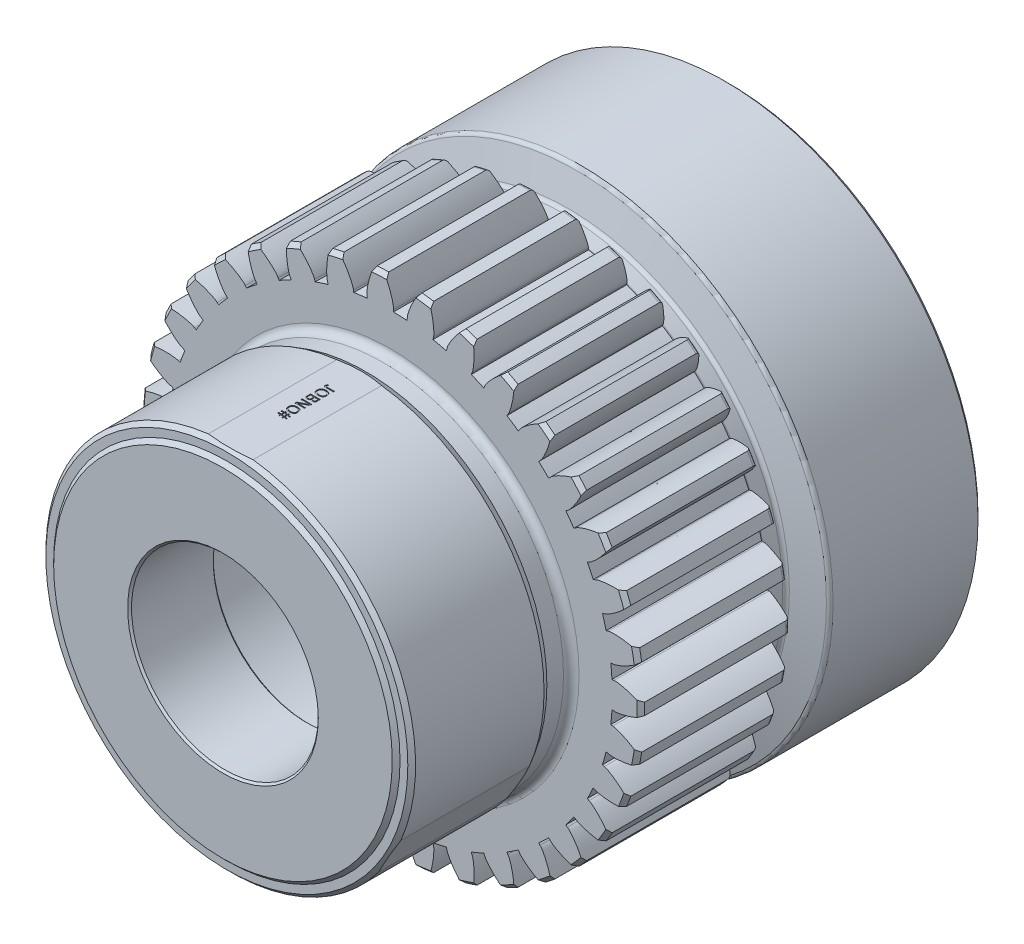
from build123d import *

# Parameters (mm, degrees)
SKETCH2_W             = 48.799180814
SKETCH2_H             = 9.344523986
CUT_EXTRUDE1_DEPTH    = 40
CIRPATTERN1_COUNT     = 3
CUT_EXTRUDE2_DEPTH    = 86
SKETCH7_R             = 42
CUT_EXTRUDE3_DEPTH    = 56
CUT_EXTRUDE6_DEPTH    = 0.2
SKETCH10_R            = 2.5
BOSS_EXTRUDE1_DEPTH   = 10
BOSS_EXTRUDE1_2_DEPTH = 10


with BuildPart() as part:
    # Sketch1 → Revolve1 (revolve)
    with BuildSketch(Plane(origin=(0, 0, 0), x_dir=(0, 0, -1), z_dir=(1, 0, 0))):
        with BuildLine():
            Line((0.5, 24), (0, 24.5))
            Line((0, 24.5), (0, 43.5))
            Line((0, 43.5), (1, 44.5))
            Line((1, 44.5), (1, 46.5))
            Line((1, 46.5), (2, 47.5))
            Line((2, 47.5), (35, 47.5))
            Line((35, 47.5), (36.732050808, 46.5))
            Line((36.732050808, 46.5), (41, 46.5))
            ThreePointArc((41, 46.5), (42.414213562, 47.085786438), (43, 48.5))
            Line((43, 48.5), (43, 63.375))
            Line((43, 63.375), (44, 64.375))
            Line((44, 64.375), (80.232673012, 64.375))
            ThreePointArc((80.232673012, 64.375), (80.841434441, 64.16835334), (81.198598838, 63.633819045))
            Line((81.198598838, 63.633819045), (83.045475648, 56.741180955))
            ThreePointArc((83.045475648, 56.741180955), (83.402640046, 56.20664666), (84.011401475, 56))
            Line((84.011401475, 56), (87.82113028, 56))
            ThreePointArc((87.82113028, 56), (88.429891709, 56.20664666), (88.787056106, 56.741180955))
            Line((88.787056106, 56.741180955), (90.801401162, 64.258819045))
            ThreePointArc((90.801401162, 64.258819045), (91.158565559, 64.79335334), (91.767326988, 65))
            Line((91.767326988, 65), (129, 65))
            Line((129, 65), (130, 64))
            Line((130, 64), (130, 48.3))
            Line((130, 48.3), (129.5, 47.8))
            Line((129.5, 47.8), (115, 47.8))
            Line((115, 47.8), (114.008181112, 45.075))
            Line((114.008181112, 45.075), (83.5, 45.075))
            Line((83.5, 45.075), (75.63242336, 47.69737732))
            ThreePointArc((75.63242336, 47.69737732), (73.830565675, 47.422474456), (73, 45.8))
            Line((73, 45.8), (73, 45.5))
            Line((73, 45.5), (72, 44.5))
            Line((72, 44.5), (61.822875656, 44.5))
            ThreePointArc((61.822875656, 44.5), (59.677124344, 44.822875656), (58.5, 43))
            Line((58.5, 43), (58.5, 33.077350269))
            Line((58.5, 33.077350269), (57.5, 32.5))
            Line((57.5, 32.5), (25.322875656, 32.5))
            ThreePointArc((25.322875656, 32.5), (23.177124344, 32.822875656), (22, 31))
            Line((22, 31), (22, 24.5))
            Line((22, 24.5), (21.5, 24))
            Line((21.5, 24), (0.5, 24))
        make_face()
    revolve(axis=Axis((0, 0, 0), (0, 0, -1)))

    # Sketch2 → Cut-Extrude1 (cut)
    with BuildSketch(Plane.XY):
        with Locations((0, 51.822261993)):
            Rectangle(SKETCH2_W, SKETCH2_H)
    cut_extrude1 = extrude(amount=-CUT_EXTRUDE1_DEPTH, mode=Mode.SUBTRACT)

    # CirPattern1: Cut-Extrude1 ×3 about axis
    cirpattern1_axis = Axis((0, 0, 0), (0, 0, 1))
    for i in range(1, CIRPATTERN1_COUNT):
        add(cut_extrude1.rotate(cirpattern1_axis, i * 360 / CIRPATTERN1_COUNT), mode=Mode.SUBTRACT)

    # Sketch5 → Cut-Extrude2 (cut)
    with BuildSketch(Plane.XY):
        with BuildLine():
            Line((0.809078869, 57.550486049), (0.801963492, 57.044363039))
            ThreePointArc((0.801963492, 57.044363039), (2.560835276, 56.992496196), (4.317270843, 56.886410262))
            Line((4.317270843, 56.886410262), (4.355575594, 57.391131844))
            add(Edge.make_bspline(
                [(4.355575594, 57.391131844), (4.346875079, 57.85506043), (4.567029851, 58.642851275), (4.975808482, 59.843985909), (5.520651508, 61.102397885), (6.290367758, 62.58886443), (6.95931702, 63.67765681), (7.357709253, 64.276596925), (7.391290214, 64.326754379)],
                knots=[0, 0, 0, 0, 0.090296499, 0.160370269, 0.250398594, 0.360381481, 0.490318935, 0.502221087, 0.502221087, 0.502221087, 0.502221087], degree=3))
            ThreePointArc((7.391290214, 64.326754379), (2.906469498, 64.684734946), (-1.592383706, 64.730416453))
            add(Edge.make_bspline(
                [(0.809078869, 57.550486049), (0.859351587, 58.011764799), (0.710736722, 58.816125515), (0.411328696, 60.049080995), (-0.01845852, 61.351285879), (-0.651759757, 62.900794032), (-1.220365409, 64.045193167), (-1.56343643, 64.677449425), (-1.592383706, 64.730416453)],
                knots=[0, 0, 0, 0, 0.090296499, 0.160370269, 0.250398594, 0.360381481, 0.490318935, 0.502221085, 0.502221085, 0.502221085, 0.502221085], degree=3))
        make_face()
        with BuildLine():
            Line((-5.962002589, 57.246550797), (-5.909570248, 56.743100721))
            ThreePointArc((-5.909570248, 56.743100721), (-7.656721548, 56.533858131), (-9.396588722, 56.270832768))
            Line((-9.396588722, 56.270832768), (-9.479959444, 56.770092672))
            add(Edge.make_bspline(
                [(-9.479959444, 56.770092672), (-9.512859131, 57.232935024), (-9.802709846, 57.997833123), (-10.317458963, 59.157513134), (-10.972856982, 60.362049579), (-11.872656172, 61.773576196), (-12.636464453, 62.798055907), (-13.086915896, 63.358893851), (-13.124855605, 63.40584094)],
                knots=[0, 0, 0, 0, 0.090296499, 0.160370269, 0.250398594, 0.360381481, 0.490318935, 0.502221085, 0.502221085, 0.502221085, 0.502221085], degree=3))
            ThreePointArc((-13.124855605, 63.40584094), (-8.690144076, 64.164194813), (-4.213476374, 64.612762801))
            add(Edge.make_bspline(
                [(-5.962002589, 57.246550797), (-6.053400931, 57.701470323), (-5.977449624, 58.515911198), (-5.789711103, 59.770733347), (-5.478322064, 61.106207604), (-4.986394322, 62.706224163), (-4.522606735, 63.896964705), (-4.237561717, 64.557415286), (-4.213476374, 64.612762801)],
                knots=[0, 0, 0, 0, 0.090296499, 0.160370269, 0.250398594, 0.360381481, 0.490318935, 0.502221087, 0.502221087, 0.502221087, 0.502221087], degree=3))
        make_face()
        with BuildLine():
            Line((11.072112722, 56.481159451), (10.974739939, 55.984440546))
            ThreePointArc((10.974739939, 55.984440546), (12.696084748, 55.619348541), (14.405351297, 55.20134377))
            Line((14.405351297, 55.20134377), (14.533161993, 55.691114691))
            add(Edge.make_bspline(
                [(14.533161993, 55.691114691), (14.607438947, 56.149141291), (14.964721228, 56.884961861), (15.581401489, 57.993803524), (16.342186798, 59.134706823), (17.364952241, 60.459847095), (18.217562601, 61.411696631), (18.716497393, 61.929875852), (18.758494654, 61.973231143)],
                knots=[0, 0, 0, 0, 0.090296499, 0.160370269, 0.250398594, 0.360381481, 0.490318935, 0.502221087, 0.502221087, 0.502221087, 0.502221087], degree=3))
            ThreePointArc((18.758494654, 61.973231143), (14.40966675, 63.126254476), (9.991268716, 63.97450312))
            add(Edge.make_bspline(
                [(11.072112722, 56.481159451), (11.203942038, 56.926048722), (11.201339626, 57.744019239), (11.126895913, 59.010621985), (10.936533215, 60.368641371), (10.590084753, 62.006328593), (10.234957184, 63.233865223), (10.01029317, 63.917218559), (9.991268716, 63.97450312)],
                knots=[0, 0, 0, 0, 0.090296499, 0.160370269, 0.250398594, 0.360381481, 0.490318935, 0.502221085, 0.502221085, 0.502221085, 0.502221085], degree=3))
        make_face()
        with BuildLine():
            Line((20.979279762, 53.596481916), (20.794779214, 53.12513207))
            ThreePointArc((20.794779214, 53.12513207), (22.423271609, 52.458549259), (24.030431907, 51.74206067))
            Line((24.030431907, 51.74206067), (24.243640608, 52.20113929))
            add(Edge.make_bspline(
                [(24.243640608, 52.20113929), (24.398507708, 52.638542551), (24.881434152, 53.298742967), (25.686195432, 54.279652576), (26.638470758, 55.266377627), (27.881412872, 56.387600529), (28.89028073, 57.171913993), (29.473721908, 57.592677613), (29.522785642, 57.627837266)],
                knots=[0, 0, 0, 0, 0.090296499, 0.160370269, 0.250398594, 0.360381481, 0.490318935, 0.502221087, 0.502221087, 0.502221087, 0.502221087], degree=3))
            ThreePointArc((29.522785642, 57.627837266), (25.449725457, 59.538844246), (21.253793541, 61.162396619))
            add(Edge.make_bspline(
                [(20.979279762, 53.596481916), (21.188428573, 54.0106826), (21.331922259, 54.815972673), (21.48483554, 56.075513029), (21.540015773, 57.445699057), (21.491555226, 59.118928734), (21.361319832, 60.390148821), (21.26228371, 61.102635697), (21.253793541, 61.162396619)],
                knots=[0, 0, 0, 0, 0.090296499, 0.160370269, 0.250398594, 0.360381481, 0.490318935, 0.502221085, 0.502221085, 0.502221085, 0.502221085], degree=3))
        make_face()
        with BuildLine():
            Line((30.212155488, 48.989169352), (29.946457175, 48.558338137))
            ThreePointArc((29.946457175, 48.558338137), (31.42975607, 47.611689041), (32.883154664, 46.619745166))
            Line((32.883154664, 46.619745166), (33.174908666, 47.03337632))
            add(Edge.make_bspline(
                [(33.174908666, 47.03337632), (33.405388356, 47.436097743), (33.99843731, 47.99945862), (34.965413919, 48.820908933), (36.07857235, 49.621741582), (37.501741953, 50.503010085), (38.634441465, 51.094578997), (39.283636749, 51.404403328), (39.338190007, 51.430237283)],
                knots=[0, 0, 0, 0, 0.090296499, 0.160370269, 0.250398594, 0.360381481, 0.490318935, 0.502221087, 0.502221087, 0.502221087, 0.502221087], degree=3))
            ThreePointArc((39.338190007, 51.430237283), (35.671809047, 54.037806574), (31.833203953, 56.384480365))
            add(Edge.make_bspline(
                [(30.212155488, 48.989169352), (30.49190158, 49.359368699), (30.776879358, 50.126095642), (31.152234875, 51.338090946), (31.451184501, 52.67640471), (31.70226943, 54.331397862), (31.801112084, 55.605443347), (31.830886958, 56.324163848), (31.833203953, 56.384480365)],
                knots=[0, 0, 0, 0, 0.090296499, 0.160370269, 0.250398594, 0.360381481, 0.490318935, 0.502221085, 0.502221085, 0.502221085, 0.502221085], degree=3))
        make_face()
        with BuildLine():
            Line((38.473987678, 42.807304578), (38.135631363, 42.430839263))
            ThreePointArc((38.135631363, 42.430839263), (39.426062311, 41.234549963), (40.678985774, 39.999032694))
            Line((40.678985774, 39.999032694), (41.039907863, 40.353921936))
            add(Edge.make_bspline(
                [(41.039907863, 40.353921936), (41.338592336, 40.709017723), (42.022702719, 41.157432179), (43.120815233, 41.793021107), (44.359078941, 42.382221932), (45.91673419, 42.995211343), (47.136859463, 43.375022192), (47.830943182, 43.563949225), (47.889232578, 43.579627157)],
                knots=[0, 0, 0, 0, 0.090296499, 0.160370269, 0.250398594, 0.360381481, 0.490318935, 0.502221087, 0.502221087, 0.502221087, 0.502221087], degree=3))
            ThreePointArc((47.889232578, 43.579627157), (44.747371344, 46.799949336), (41.389468999, 49.79432052))
            add(Edge.make_bspline(
                [(38.473987678, 42.807304578), (38.815339781, 43.121604075), (39.232642231, 43.825124653), (39.818375748, 44.950620379), (40.351486281, 46.214047373), (40.89404661, 47.797611159), (41.218790428, 49.033533171), (41.376419308, 49.735387029), (41.389468999, 49.79432052)],
                knots=[0, 0, 0, 0, 0.090296499, 0.160370269, 0.250398594, 0.360381481, 0.490318935, 0.502221085, 0.502221085, 0.502221085, 0.502221085], degree=3))
        make_face()
        with BuildLine():
            Line((45.499234248, 35.249577812), (45.09909498, 34.939578303))
            ThreePointArc((45.09909498, 34.939578303), (46.15518247, 33.53209852), (47.16736081, 32.092718399))
            Line((47.16736081, 32.092718399), (47.585850654, 32.377459298))
            add(Edge.make_bspline(
                [(47.585850654, 32.377459298), (47.943139946, 32.673516377), (48.696323886, 32.992572003), (49.890278065, 33.421871195), (51.213848236, 33.780502798), (52.85592481, 34.105511133), (54.124260014, 34.261356485), (54.840923746, 34.323313948), (54.90107581, 34.328331956)],
                knots=[0, 0, 0, 0, 0.090296499, 0.160370269, 0.250398594, 0.360381481, 0.490318935, 0.502221087, 0.502221087, 0.502221087, 0.502221087], degree=3))
            ThreePointArc((54.90107581, 34.328331956), (52.384716307, 38.057903219), (49.615442455, 41.603730242))
            add(Edge.make_bspline(
                [(45.499234248, 35.249577812), (45.891221024, 35.497875615), (46.427435702, 36.115578099), (47.204721263, 37.118399887), (47.954858091, 38.266332528), (48.771455485, 39.727569905), (49.311662932, 40.885644894), (49.592079497, 41.548073949), (49.615442455, 41.603730242)],
                knots=[0, 0, 0, 0, 0.090296499, 0.160370269, 0.250398594, 0.360381481, 0.490318935, 0.502221085, 0.502221085, 0.502221085, 0.502221085], degree=3))
        make_face()
        with BuildLine():
            Line((51.062097992, 26.558900611), (50.613036577, 26.325330547))
            ThreePointArc((50.613036577, 26.325330547), (51.400837087, 24.751897841), (52.13973806, 23.15491773))
            Line((52.13973806, 23.15491773), (52.602345051, 23.360358478))
            add(Edge.make_bspline(
                [(52.602345051, 23.360358478), (53.006755589, 23.587861331), (53.804805135, 23.767303417), (55.05622631, 23.976514843), (56.42256231, 24.093050509), (58.096282517, 24.119631732), (59.372062314, 24.046502589), (60.088271898, 23.979499121), (60.148353293, 23.973695921)],
                knots=[0, 0, 0, 0, 0.090296499, 0.160370269, 0.250398594, 0.360381481, 0.490318935, 0.502221087, 0.502221087, 0.502221087, 0.502221087], degree=3))
            ThreePointArc((60.148353293, 23.973695921), (58.338373386, 28.092644778), (56.246734767, 32.075961842))
            add(Edge.make_bspline(
                [(51.062097992, 26.558900611), (51.492120665, 26.733216226), (52.13001319, 27.245247148), (53.073868196, 28.093163482), (54.016921305, 29.08870627), (55.081309651, 30.380651866), (55.819618016, 31.42365835), (56.213809446, 32.025371586), (56.246734767, 32.075961842)],
                knots=[0, 0, 0, 0, 0.090296499, 0.160370269, 0.250398594, 0.360381481, 0.490318935, 0.502221085, 0.502221085, 0.502221085, 0.502221085], degree=3))
        make_face()
        with BuildLine():
            Line((54.983783893, 17.014598493), (54.500233534, 16.864965008))
            ThreePointArc((54.500233534, 16.864965008), (54.994426508, 15.1761508), (55.436301228, 13.472898952))
            Line((55.436301228, 13.472898952), (55.928156796, 13.592436516))
            add(Edge.make_bspline(
                [(55.928156796, 13.592436516), (56.366690494, 13.744073014), (57.183955677, 13.778134143), (58.452622142, 13.760533576), (59.817808806, 13.631227753), (61.469377901, 13.358527522), (62.71159768, 13.058774315), (63.40433355, 12.864963461), (63.462413211, 12.848525574)],
                knots=[0, 0, 0, 0, 0.090296499, 0.160370269, 0.250398594, 0.360381481, 0.490318935, 0.502221087, 0.502221087, 0.502221087, 0.502221087], degree=3))
            ThreePointArc((63.462413211, 12.848525574), (62.416987144, 17.22446562), (61.070210743, 21.517245637))
            add(Edge.make_bspline(
                [(54.983783893, 17.014598493), (55.438021179, 17.10932927), (56.15708916, 17.499231537), (57.237177336, 18.164989687), (58.342836222, 18.976145059), (59.620805203, 20.05727468), (60.533484648, 20.951689571), (61.028781307, 21.47334743), (61.070210743, 21.517245637)],
                knots=[0, 0, 0, 0, 0.090296499, 0.160370269, 0.250398594, 0.360381481, 0.490318935, 0.502221085, 0.502221085, 0.502221085, 0.502221085], degree=3))
        make_face()
        with BuildLine():
            Line((57.138245739, 6.923433179), (56.635748143, 6.862545616))
            ThreePointArc((56.635748143, 6.862545616), (56.820449811, 5.112629784), (56.951096061, 3.357850117))
            Line((56.951096061, 3.357850117), (57.456391565, 3.387642459))
            add(Edge.make_bspline(
                [(57.456391565, 3.387642459), (57.914953588, 3.458538882), (58.725166833, 3.346124301), (59.970302603, 3.102277438), (61.290461709, 2.731286121), (62.866796903, 2.168069245), (64.035530698, 1.65132629), (64.682527752, 1.33693729), (64.736738951, 1.310393043)],
                knots=[0, 0, 0, 0, 0.090296499, 0.160370269, 0.250398594, 0.360381481, 0.490318935, 0.502221087, 0.502221087, 0.502221087, 0.502221087], degree=3))
            ThreePointArc((64.736738951, 1.310393043), (64.489467578, 5.802677964), (63.930839898, 10.266947452))
            add(Edge.make_bspline(
                [(57.138245739, 6.923433179), (57.602098078, 6.935534395), (58.379230079, 7.190776226), (59.560836501, 7.652978178), (60.793564378, 8.253674931), (62.244039021, 9.089240181), (63.301755277, 9.80631625), (63.882237922, 10.231152219), (63.930839898, 10.266947452)],
                knots=[0, 0, 0, 0, 0.090296499, 0.160370269, 0.250398594, 0.360381481, 0.490318935, 0.502221085, 0.502221085, 0.502221085, 0.502221085], degree=3))
        make_face()
        with BuildLine():
            Line((57.456237353, -3.390256974), (56.950943206, -3.360441638))
            ThreePointArc((56.950943206, -3.360441638), (56.820217105, -5.115215359), (56.635435808, -6.865122784))
            Line((56.635435808, -6.865122784), (57.137930633, -6.926033213))
            add(Edge.make_bspline(
                [(57.137930633, -6.926033213), (57.601782421, -6.938155536), (58.378902807, -7.193432729), (59.560488194, -7.65568845), (60.793188743, -8.256441294), (62.243625326, -9.09207256), (63.30130907, -9.809196721), (63.881772292, -10.234059146), (63.930372636, -10.269856599)],
                knots=[0, 0, 0, 0, 0.090296499, 0.160370269, 0.250398594, 0.360381481, 0.490318935, 0.502221087, 0.502221087, 0.502221087, 0.502221087], degree=3))
            ThreePointArc((63.930372636, -10.269856599), (64.489203461, -5.805612536), (64.736679255, -1.313338871))
            add(Edge.make_bspline(
                [(57.456237353, -3.390256974), (57.914796149, -3.461174263), (58.725014508, -3.34879655), (59.970161374, -3.105006347), (61.290337355, -2.7340751), (62.866698209, -2.170929975), (64.035455406, -1.654240144), (64.682466848, -1.339880643), (64.736679255, -1.313338871)],
                knots=[0, 0, 0, 0, 0.090296499, 0.160370269, 0.250398594, 0.360381481, 0.490318935, 0.502221085, 0.502221085, 0.502221085, 0.502221085], degree=3))
        make_face()
        with BuildLine():
            Line((55.927538223, -13.594981478), (55.435688094, -13.475421533))
            ThreePointArc((55.435688094, -13.475421533), (54.993735869, -15.178653272), (54.499466048, -16.86744499))
            Line((54.499466048, -16.86744499), (54.983009597, -17.017100479))
            add(Edge.make_bspline(
                [(54.983009597, -17.017100479), (55.437242572, -17.111851926), (56.156292811, -17.501786913), (57.236350688, -18.167594211), (58.34197267, -18.978799893), (59.619892416, -20.059987673), (60.532531284, -20.954444078), (61.027804108, -21.4761245), (61.069231543, -21.5200246)],
                knots=[0, 0, 0, 0, 0.090296499, 0.160370269, 0.250398594, 0.360381481, 0.490318935, 0.502221087, 0.502221087, 0.502221087, 0.502221087], degree=3))
            ThreePointArc((61.069231543, -21.5200246), (62.416203284, -17.227305872), (63.461828476, -12.851413403))
            add(Edge.make_bspline(
                [(55.927538223, -13.594981478), (56.36606502, -13.746637932), (57.183328652, -13.780736249), (58.451995917, -13.763193413), (59.817188459, -13.633949707), (61.46876999, -13.361324655), (62.71100331, -13.061627899), (63.403748068, -12.867848638), (63.461828476, -12.851413403)],
                knots=[0, 0, 0, 0, 0.090296499, 0.160370269, 0.250398594, 0.360381481, 0.490318935, 0.502221085, 0.502221085, 0.502221085, 0.502221085], degree=3))
        make_face()
        with BuildLine():
            Line((52.601281997, -23.362752092), (52.138684355, -23.157290292))
            ThreePointArc((52.138684355, -23.157290292), (51.399710714, -24.754236779), (50.611838607, -26.327633635))
            Line((50.611838607, -26.327633635), (51.060889393, -26.561224133))
            add(Edge.make_bspline(
                [(51.060889393, -26.561224133), (51.490904132, -26.735559315), (52.128773358, -27.247619265), (53.072589777, -28.095578547), (54.015597591, -29.091164247), (55.079927109, -30.383158276), (55.818188136, -31.426198362), (56.212352086, -32.027929542), (56.245275099, -32.078521303)],
                knots=[0, 0, 0, 0, 0.090296499, 0.160370269, 0.250398594, 0.360381481, 0.490318935, 0.502221087, 0.502221087, 0.502221087, 0.502221087], degree=3))
            ThreePointArc((56.245275099, -32.078521303), (58.337094977, -28.095299423), (60.147262313, -23.976432933))
            add(Edge.make_bspline(
                [(52.601281997, -23.362752092), (53.005682183, -23.590273347), (53.803723563, -23.769751747), (55.055135217, -23.979020119), (56.421465908, -24.095617953), (58.095184927, -24.122275368), (59.370967969, -24.049204186), (60.087180657, -23.98223339), (60.147262313, -23.976432933)],
                knots=[0, 0, 0, 0, 0.090296499, 0.160370269, 0.250398594, 0.360381481, 0.490318935, 0.502221085, 0.502221085, 0.502221085, 0.502221085], degree=3))
        make_face()
        with BuildLine():
            Line((47.584377288, -32.37962463), (47.165900401, -32.094864688))
            ThreePointArc((47.165900401, -32.094864688), (46.153656564, -33.534198749), (45.097505029, -34.941630473))
            Line((45.097505029, -34.941630473), (45.497630191, -35.25164819))
            add(Edge.make_bspline(
                [(45.497630191, -35.25164819), (45.889605668, -35.49996383), (46.425792237, -36.117690714), (47.203032163, -37.12054787), (47.953116762, -38.268514646), (48.769647624, -39.729789173), (49.309802494, -40.887888772), (49.590188816, -41.550330575), (49.613549235, -41.605987938)],
                knots=[0, 0, 0, 0, 0.090296499, 0.160370269, 0.250398594, 0.360381481, 0.490318935, 0.502221087, 0.502221087, 0.502221087, 0.502221087], degree=3))
            ThreePointArc((49.613549235, -41.605987938), (52.382984437, -38.060286933), (54.899513651, -34.330830181))
            add(Edge.make_bspline(
                [(47.584377288, -32.37962463), (47.941653108, -32.675697967), (48.694822528, -32.994787865), (49.888757172, -33.424141388), (51.212311019, -33.782833212), (52.85437282, -34.107916302), (54.122700867, -34.263819262), (54.839361819, -34.325809428), (54.899513651, -34.330830181)],
                knots=[0, 0, 0, 0, 0.090296499, 0.160370269, 0.250398594, 0.360381481, 0.490318935, 0.502221085, 0.502221085, 0.502221085, 0.502221085], degree=3))
        make_face()
        with BuildLine():
            Line((41.03807154, -40.355789391), (40.6771656, -40.000883725))
            ThreePointArc((40.6771656, -40.000883725), (39.424185918, -41.236343979), (38.133700534, -42.432574558))
            Line((38.133700534, -42.432574558), (38.472039718, -42.809055269))
            add(Edge.make_bspline(
                [(38.472039718, -42.809055269), (38.813377518, -43.123370298), (39.230647955, -43.826909866), (39.816330255, -44.952432243), (40.349383304, -46.215883497), (40.891871537, -47.799471957), (41.216559228, -49.035408795), (41.374156075, -49.737269797), (41.387203077, -49.796203886)],
                knots=[0, 0, 0, 0, 0.090296499, 0.160370269, 0.250398594, 0.360381481, 0.490318935, 0.502221087, 0.502221087, 0.502221087, 0.502221087], degree=3))
            ThreePointArc((41.387203077, -49.796203886), (44.745241677, -46.801985506), (47.887249447, -43.5818063))
            add(Edge.make_bspline(
                [(41.03807154, -40.355789391), (41.336739855, -40.710898768), (42.020829831, -41.159344354), (43.118913422, -41.794983251), (44.357150316, -42.384240415), (45.914777681, -42.997300742), (47.134885626, -43.377166996), (47.828960771, -43.566125708), (47.887249447, -43.5818063)],
                knots=[0, 0, 0, 0, 0.090296499, 0.160370269, 0.250398594, 0.360381481, 0.490318935, 0.502221085, 0.502221085, 0.502221085, 0.502221085], degree=3))
        make_face()
        with BuildLine():
            Line((33.172768407, -47.034885875), (32.881033227, -46.621241445))
            ThreePointArc((32.881033227, -46.621241445), (31.427589497, -47.613119184), (29.944247526, -48.559700782))
            Line((29.944247526, -48.559700782), (30.209926235, -48.990544087))
            add(Edge.make_bspline(
                [(30.209926235, -48.990544087), (30.48965548, -49.360756163), (30.774598369, -50.127496073), (31.149898733, -51.339508456), (31.448787467, -52.677835826), (31.699797053, -54.332840382), (31.798581835, -55.606890432), (31.828323915, -56.325612243), (31.830638158, -56.385928869)],
                knots=[0, 0, 0, 0, 0.090296499, 0.160370269, 0.250398594, 0.360381481, 0.490318935, 0.502221087, 0.502221087, 0.502221087, 0.502221087], degree=3))
            ThreePointArc((31.830638158, -56.385928869), (35.669350033, -54.039429755), (39.335849645, -51.432027305))
            add(Edge.make_bspline(
                [(33.172768407, -47.034885875), (33.403229771, -47.437617786), (33.996253089, -48.001005648), (34.963192317, -48.822499963), (36.076314305, -49.623383257), (37.499443809, -50.504716559), (38.632116379, -51.096336891), (39.281297569, -51.406190862), (39.335849645, -51.432027305)],
                knots=[0, 0, 0, 0, 0.090296499, 0.160370269, 0.250398594, 0.360381481, 0.490318935, 0.502221085, 0.502221085, 0.502221085, 0.502221085], degree=3))
        make_face()
        with BuildLine():
            Line((24.241265202, -52.202242428), (24.028077392, -51.743154106))
            ThreePointArc((24.028077392, -51.743154106), (22.420884491, -52.459569562), (20.792361766, -53.126078269))
            Line((20.792361766, -53.126078269), (20.976840865, -53.59743651))
            add(Edge.make_bspline(
                [(20.976840865, -53.59743651), (21.185970828, -54.01164671), (21.32942787, -54.816943312), (21.482283835, -56.076490625), (21.537401724, -57.446679167), (21.488865009, -59.119906612), (21.358571858, -60.391120858), (21.259503236, -61.103603166), (21.251010338, -61.163363704)],
                knots=[0, 0, 0, 0, 0.090296499, 0.160370269, 0.250398594, 0.360381481, 0.490318935, 0.502221087, 0.502221087, 0.502221087, 0.502221087], degree=3))
            ThreePointArc((21.251010338, -61.163363704), (25.447016129, -59.540002268), (29.52016327, -57.629180634))
            add(Edge.make_bspline(
                [(24.241265202, -52.202242428), (24.396112398, -52.639652736), (24.8790088, -53.299875126), (25.683725443, -54.280821356), (26.635955868, -55.267589731), (27.878846959, -56.388869229), (28.887679125, -57.173228476), (29.471101143, -57.594018744), (29.52016327, -57.629180634)],
                knots=[0, 0, 0, 0, 0.090296499, 0.160370269, 0.250398594, 0.360381481, 0.490318935, 0.502221085, 0.502221085, 0.502221085, 0.502221085], degree=3))
        make_face()
        with BuildLine():
            Line((14.530627788, -55.691775956), (14.402839379, -55.20199922))
            ThreePointArc((14.402839379, -55.20199922), (12.69355381, -55.619926211), (10.97219239, -55.984939887))
            Line((10.97219239, -55.984939887), (11.06954257, -56.481663222))
            add(Edge.make_bspline(
                [(11.06954257, -56.481663222), (11.201351641, -56.926558492), (11.198712009, -57.74452889), (11.124210659, -59.011128245), (10.933786169, -60.369138974), (10.587263162, -62.006810399), (10.232079808, -63.234330969), (10.00738463, -63.917674008), (9.988357561, -63.974957704)],
                knots=[0, 0, 0, 0, 0.090296499, 0.160370269, 0.250398594, 0.360381481, 0.490318935, 0.502221087, 0.502221087, 0.502221087, 0.502221087], degree=3))
            ThreePointArc((9.988357561, -63.974957704), (14.40679419, -63.126910119), (18.755674558, -61.97408468))
            add(Edge.make_bspline(
                [(14.530627788, -55.691775956), (14.604883899, -56.149805935), (14.962132697, -56.885642762), (15.5787625, -57.994512487), (16.339495894, -59.135450397), (17.362201028, -60.460637246), (18.214768094, -61.412525455), (18.713679278, -61.930727475), (18.755674558, -61.97408468)],
                knots=[0, 0, 0, 0, 0.090296499, 0.160370269, 0.250398594, 0.360381481, 0.490318935, 0.502221085, 0.502221085, 0.502221085, 0.502221085], degree=3))
        make_face()
        with BuildLine():
            Line((4.352964041, -57.391329982), (4.314682257, -56.886606658))
            ThreePointArc((4.314682257, -56.886606658), (2.558241865, -56.992612667), (0.799367722, -57.044399473))
            Line((0.799367722, -57.044399473), (0.806460069, -57.550522806))
            add(Edge.make_bspline(
                [(0.806460069, -57.550522806), (0.856711796, -58.011803844), (0.708060329, -58.816157796), (0.408596199, -60.049099649), (-0.021250269, -61.351284981), (-0.654622034, -62.900764281), (-1.223279707, -64.045137653), (-1.566379551, -64.677378216), (-1.595329247, -64.730343925)],
                knots=[0, 0, 0, 0, 0.090296499, 0.160370269, 0.250398594, 0.360381481, 0.490318935, 0.502221087, 0.502221087, 0.502221087, 0.502221087], degree=3))
            ThreePointArc((-1.595329247, -64.730343925), (2.903526031, -64.684867137), (7.388363033, -64.327090652))
            add(Edge.make_bspline(
                [(4.352964041, -57.391329982), (4.344242415, -57.855258172), (4.564361339, -58.643059034), (4.973085313, -59.844212269), (5.517871078, -61.10264903), (6.28751967, -62.589150634), (6.956419431, -63.677973337), (7.354784362, -64.276931668), (7.388363033, -64.327090652)],
                knots=[0, 0, 0, 0, 0.090296499, 0.160370269, 0.250398594, 0.360381481, 0.490318935, 0.502221085, 0.502221085, 0.502221085, 0.502221085], degree=3))
        make_face()
        with BuildLine():
            Line((-5.964607552, -57.246279441), (-5.912152302, -56.742831751))
            ThreePointArc((-5.912152302, -56.742831751), (-7.659294078, -56.533509658), (-9.399149282, -56.270405124))
            Line((-9.399149282, -56.270405124), (-9.482542723, -56.769661234))
            add(Edge.make_bspline(
                [(-9.482542723, -56.769661234), (-9.515463471, -57.232502088), (-9.805348992, -57.997386997), (-10.320150879, -59.157043582), (-10.975603707, -60.361550209), (-11.875467139, -61.773035844), (-12.639322005, -62.797480917), (-13.089799006, -63.358298271), (-13.12774086, -63.405243631)],
                knots=[0, 0, 0, 0, 0.090296499, 0.160370269, 0.250398594, 0.360381481, 0.490318935, 0.502221087, 0.502221087, 0.502221087, 0.502221087], degree=3))
            ThreePointArc((-13.12774086, -63.405243631), (-8.693063843, -64.163799303), (-4.216416559, -64.612571001))
            add(Edge.make_bspline(
                [(-5.964607552, -57.246279441), (-6.056026595, -57.701194807), (-5.980112348, -58.515639137), (-5.792430929, -59.770469829), (-5.481102655, -61.105958248), (-4.989247743, -62.705997222), (-4.525514278, -63.89675876), (-4.240499374, -64.55722239), (-4.216416559, -64.612571001)],
                knots=[0, 0, 0, 0, 0.090296499, 0.160370269, 0.250398594, 0.360381481, 0.490318935, 0.502221085, 0.502221085, 0.502221085, 0.502221085], degree=3))
        make_face()
        with BuildLine():
            Line((-16.090471751, -55.261286376), (-15.948965422, -54.775295544))
            ThreePointArc((-15.948965422, -54.775295544), (-17.630654008, -54.257373133), (-19.295569894, -53.687833654))
            Line((-19.295569894, -53.687833654), (-19.466768789, -54.164176039))
            add(Edge.make_bspline(
                [(-19.466768789, -54.164176039), (-19.581803913, -54.613700624), (-20.003606328, -55.31453246), (-20.717199816, -56.36363146), (-21.577192211, -57.431745548), (-22.714624959, -58.659871208), (-23.649126094, -59.531461474), (-24.192501549, -60.002830488), (-24.23821608, -60.042246637)],
                knots=[0, 0, 0, 0, 0.090296499, 0.160370269, 0.250398594, 0.360381481, 0.490318935, 0.502221087, 0.502221087, 0.502221087, 0.502221087], degree=3))
            ThreePointArc((-24.23821608, -60.042246637), (-20.010251493, -61.580454165), (-15.685677053, -62.821350156))
            add(Edge.make_bspline(
                [(-16.090471751, -55.261286376), (-16.261649927, -55.692567565), (-16.332380304, -56.507478451), (-16.371773674, -57.775655309), (-16.303909239, -59.145271689), (-16.105656628, -60.807421465), (-15.861994233, -62.061849783), (-15.699489971, -62.762590867), (-15.685677053, -62.821350156)],
                knots=[0, 0, 0, 0, 0.090296499, 0.160370269, 0.250398594, 0.360381481, 0.490318935, 0.502221085, 0.502221085, 0.502221085, 0.502221085], degree=3))
        make_face()
        with BuildLine():
            Line((-25.699174948, -51.500150098), (-25.47316567, -51.047236269))
            ThreePointArc((-25.47316567, -51.047236269), (-27.035350211, -50.237359992), (-28.571815013, -49.379691036))
            Line((-28.571815013, -49.379691036), (-28.825316888, -49.81780966))
            add(Edge.make_bspline(
                [(-28.825316888, -49.81780966), (-29.018769065, -50.239569885), (-29.558931298, -50.853823336), (-30.448380905, -51.758645846), (-31.485272003, -52.65603733), (-32.823716043, -53.661330045), (-33.898827812, -54.352051877), (-34.517637188, -54.718822363), (-34.569655092, -54.749442434)],
                knots=[0, 0, 0, 0, 0.090296499, 0.160370269, 0.250398594, 0.360381481, 0.490318935, 0.502221087, 0.502221087, 0.502221087, 0.502221087], degree=3))
            ThreePointArc((-34.569655092, -54.749442434), (-30.684293195, -57.017862562), (-26.65078698, -59.010999427))
            add(Edge.make_bspline(
                [(-25.699174948, -51.500150098), (-25.94461045, -51.893935377), (-26.159712118, -52.683120914), (-26.424914143, -53.92388369), (-26.602694765, -55.283607434), (-26.704416458, -56.95444515), (-26.688656643, -58.232221889), (-26.653886043, -58.950718032), (-26.65078698, -59.010999427)],
                knots=[0, 0, 0, 0, 0.090296499, 0.160370269, 0.250398594, 0.360381481, 0.490318935, 0.502221085, 0.502221085, 0.502221085, 0.502221085], degree=3))
        make_face()
        with BuildLine():
            Line((-34.481885517, -46.083756621), (-34.178637415, -45.678476819))
            ThreePointArc((-34.178637415, -45.678476819), (-35.571108014, -44.602676766), (-36.929738489, -43.484444519))
            Line((-36.929738489, -43.484444519), (-37.257395586, -43.870257889))
            add(Edge.make_bspline(
                [(-37.257395586, -43.870257889), (-37.523047102, -44.250698033), (-38.164207895, -44.758630487), (-39.200925979, -45.490094767), (-40.381389247, -46.187920747), (-41.877825886, -46.938069583), (-43.058993312, -47.425722611), (-43.733347566, -47.676106264), (-43.789996946, -47.696946102)],
                knots=[0, 0, 0, 0, 0.090296499, 0.160370269, 0.250398594, 0.360381481, 0.490318935, 0.502221087, 0.502221087, 0.502221087, 0.502221087], degree=3))
            ThreePointArc((-43.789996946, -47.696946102), (-40.372116467, -50.622669941), (-36.759318686, -53.303986622))
            add(Edge.make_bspline(
                [(-34.481885517, -46.083756621), (-34.793689846, -46.427389407), (-35.146249261, -47.165484522), (-35.628736128, -48.33895408), (-36.046447793, -49.645082548), (-36.44487437, -51.270906105), (-36.657523669, -52.53096247), (-36.751604287, -53.244120614), (-36.759318686, -53.303986622)],
                knots=[0, 0, 0, 0, 0.090296499, 0.160370269, 0.250398594, 0.360381481, 0.490318935, 0.502221085, 0.502221085, 0.502221085, 0.502221085], degree=3))
        make_face()
        with BuildLine():
            Line((-42.156319913, -39.186193288), (-41.78557963, -38.841573539))
            ThreePointArc((-41.78557963, -38.841573539), (-42.963581137, -37.534426809), (-44.100709784, -36.191572176))
            Line((-44.100709784, -36.191572176), (-44.491990934, -36.512679932))
            add(Edge.make_bspline(
                [(-44.491990934, -36.512679932), (-44.821303532, -36.839572337), (-45.542855449, -37.224858427), (-46.693521037, -37.759454614), (-47.979615414, -38.235286387), (-49.585947948, -38.706180943), (-50.835207338, -38.975091599), (-51.543432169, -39.101040882), (-51.602892267, -39.111430678)],
                knots=[0, 0, 0, 0, 0.090296499, 0.160370269, 0.250398594, 0.360381481, 0.490318935, 0.502221087, 0.502221087, 0.502221087, 0.502221087], degree=3))
            ThreePointArc((-51.602892267, -39.111430678), (-48.762346697, -42.600423056), (-45.686375643, -45.883739828))
            add(Edge.make_bspline(
                [(-42.156319913, -39.186193288), (-42.524471423, -39.468628942), (-43.003157034, -40.13191065), (-43.687421219, -41.200370713), (-44.331638329, -42.410923861), (-45.013964033, -43.939477952), (-45.448187722, -45.141314694), (-45.66809573, -45.826213351), (-45.686375643, -45.883739828)],
                knots=[0, 0, 0, 0, 0.090296499, 0.160370269, 0.250398594, 0.360381481, 0.490318935, 0.502221085, 0.502221085, 0.502221085, 0.502221085], degree=3))
        make_face()
        with BuildLine():
            Line((-48.475815502, -31.029153461), (-48.049498935, -30.756270126))
            ThreePointArc((-48.049498935, -30.756270126), (-48.975169412, -29.259789491), (-49.85424798, -27.735472924))
            Line((-49.85424798, -27.735472924), (-50.296577085, -27.9815544))
            add(Edge.make_bspline(
                [(-50.296577085, -27.9815544), (-50.678966387, -28.244392475), (-51.457718155, -28.494648789), (-52.685347909, -28.81519452), (-54.035737265, -29.053738463), (-55.700336844, -29.2302438), (-56.977535973, -29.271769073), (-57.696868452, -29.269235873), (-57.757228172, -29.268841691)],
                knots=[0, 0, 0, 0, 0.090296499, 0.160370269, 0.250398594, 0.360381481, 0.490318935, 0.502221087, 0.502221087, 0.502221087, 0.502221087], degree=3))
            ThreePointArc((-57.757228172, -29.268841691), (-55.585314983, -33.208963522), (-53.145034897, -36.988751883))
            add(Edge.make_bspline(
                [(-48.475815502, -31.029153461), (-48.888481498, -31.241314267), (-49.477907957, -31.808464149), (-50.341956646, -32.737573531), (-51.191973533, -33.813643186), (-52.136267854, -35.195798824), (-52.778109627, -36.300787922), (-53.116777, -36.935413885), (-53.145034897, -36.988751883)],
                knots=[0, 0, 0, 0, 0.090296499, 0.160370269, 0.250398594, 0.360381481, 0.490318935, 0.502221085, 0.502221085, 0.502221085, 0.502221085], degree=3))
        make_face()
        with BuildLine():
            Line((-53.237258494, -21.874811111), (-52.769067809, -21.682434886))
            ThreePointArc((-52.769067809, -21.682434886), (-53.412655445, -20.044718464), (-54.005429626, -18.387932752))
            Line((-54.005429626, -18.387932752), (-54.484589864, -18.551078686))
            add(Edge.make_bspline(
                [(-54.484589864, -18.551078686), (-54.907765563, -18.741414598), (-55.718687461, -18.848597693), (-56.98382435, -18.944790366), (-58.355106059, -18.938379479), (-60.024471083, -18.814822571), (-61.28855972, -18.627627805), (-61.99587991, -18.496693541), (-62.05519924, -18.485528049)],
                knots=[0, 0, 0, 0, 0.090296499, 0.160370269, 0.250398594, 0.360381481, 0.490318935, 0.502221087, 0.502221087, 0.502221087, 0.502221087], degree=3))
            ThreePointArc((-62.05519924, -18.485528049), (-60.621725509, -22.750140577), (-58.895569001, -26.904915017))
            add(Edge.make_bspline(
                [(-53.237258494, -21.874811111), (-53.681175552, -22.009878046), (-54.362398208, -22.462667438), (-55.378460165, -23.222563799), (-56.406956587, -24.129564196), (-57.582869129, -25.320897763), (-58.411699662, -26.293523958), (-58.858241352, -26.857479825), (-58.895569001, -26.904915017)],
                knots=[0, 0, 0, 0, 0.090296499, 0.160370269, 0.250398594, 0.360381481, 0.490318935, 0.502221085, 0.502221085, 0.502221085, 0.502221085], degree=3))
        make_face()
        with BuildLine():
            Line((-56.287612194, -12.017394332), (-55.792595425, -11.911708348))
            ThreePointArc((-55.792595425, -11.911708348), (-56.133414784, -10.185393693), (-56.420832328, -8.449389292))
            Line((-56.420832328, -8.449389292), (-56.921423095, -8.524356039))
            add(Edge.make_bspline(
                [(-56.921423095, -8.524356039), (-57.371783976, -8.636072236), (-58.188812306, -8.596737158), (-59.45079379, -8.465485061), (-60.798893729, -8.214325396), (-62.419369433, -7.794677463), (-63.62971873, -7.384779253), (-64.302292777, -7.129652259), (-64.358665146, -7.108074326)],
                knots=[0, 0, 0, 0, 0.090296499, 0.160370269, 0.250398594, 0.360381481, 0.490318935, 0.502221087, 0.502221087, 0.502221087, 0.502221087], degree=3))
            ThreePointArc((-64.358665146, -7.108074326), (-63.709703898, -11.560109394), (-62.753151057, -15.956332046))
            add(Edge.make_bspline(
                [(-56.287612194, -12.017394332), (-56.748512456, -12.071026235), (-57.49963625, -12.394902113), (-58.635054409, -12.961161759), (-59.808973644, -13.669941159), (-61.178709611, -14.632162214), (-62.167889609, -15.441164499), (-62.707953399, -15.916324266), (-62.753151057, -15.956332046)],
                knots=[0, 0, 0, 0, 0.090296499, 0.160370269, 0.250398594, 0.360381481, 0.490318935, 0.502221085, 0.502221085, 0.502221085, 0.502221085], degree=3))
        make_face()
        with BuildLine():
            Line((-57.528835725, -1.773728612), (-57.022903118, -1.758129702))
            ThreePointArc((-57.022903118, -1.758129702), (-57.049999985, 0.001298013), (-57.022823056, 1.760724493))
            Line((-57.022823056, 1.760724493), (-57.528754953, 1.776346425))
            add(Edge.make_bspline(
                [(-57.528754953, 1.776346425), (-57.991826047, 1.746840594), (-58.788700846, 1.931429582), (-60.006965801, 2.285907899), (-61.28855493, 2.773743864), (-62.80805789, 3.475994991), (-63.925766225, 4.095422181), (-64.541977047, 4.466541913), (-64.593590599, 4.497838755)],
                knots=[0, 0, 0, 0, 0.090296499, 0.160370269, 0.250398594, 0.360381481, 0.490318935, 0.502221087, 0.502221087, 0.502221087, 0.502221087], degree=3))
            ThreePointArc((-64.593590599, 4.497838755), (-64.749999983, 0.001473217), (-64.593795206, -4.494899434))
            add(Edge.make_bspline(
                [(-57.528835725, -1.773728612), (-57.991905476, -1.744201709), (-58.788788673, -1.928754436), (-60.007069759, -2.283177316), (-61.288681078, -2.770954966), (-62.808216027, -3.473136931), (-63.925952432, -4.092513308), (-64.542180227, -4.463604949), (-64.593795206, -4.494899434)],
                knots=[0, 0, 0, 0, 0.090296499, 0.160370269, 0.250398594, 0.360381481, 0.490318935, 0.502221085, 0.502221085, 0.502221085, 0.502221085], degree=3))
        make_face()
        with BuildLine():
            Line((-56.921035141, 8.526946204), (-56.420447785, 8.451956678))
            ThreePointArc((-56.420447785, 8.451956678), (-56.132951246, 10.187947999), (-55.792053332, 11.914247143))
            Line((-55.792053332, 11.914247143), (-56.287065292, 12.019955653))
            add(Edge.make_bspline(
                [(-56.287065292, 12.019955653), (-56.747963112, 12.073608529), (-57.499072169, 12.397518586), (-58.634464557, 12.963829898), (-59.808351546, 13.672662714), (-61.178043689, 14.634946107), (-62.167186995, 15.443993377), (-62.707229069, 15.919177752), (-62.752424903, 15.959187597)],
                knots=[0, 0, 0, 0, 0.090296499, 0.160370269, 0.250398594, 0.360381481, 0.490318935, 0.502221087, 0.502221087, 0.502221087, 0.502221087], degree=3))
            ThreePointArc((-62.752424903, 15.959187597), (-63.709177792, 11.563008477), (-64.358341628, 7.111002944))
            add(Edge.make_bspline(
                [(-56.921035141, 8.526946204), (-57.371390938, 8.638682895), (-58.188421056, 8.599384996), (-59.450408512, 8.468190325), (-60.798519873, 8.217092), (-62.419014702, 7.79751783), (-63.629382546, 7.387674628), (-64.301968278, 7.132578304), (-64.358341628, 7.111002944)],
                knots=[0, 0, 0, 0, 0.090296499, 0.160370269, 0.250398594, 0.360381481, 0.490318935, 0.502221085, 0.502221085, 0.502221085, 0.502221085], degree=3))
        make_face()
        with BuildLine():
            Line((-54.483745652, 18.553557954), (-54.004592839, 18.390390217))
            ThreePointArc((-54.004592839, 18.390390217), (-53.411743267, 20.047148953), (-52.768081108, 21.684836088))
            Line((-52.768081108, 21.684836088), (-53.236263039, 21.877233617))
            add(Edge.make_bspline(
                [(-53.236263039, 21.877233617), (-53.680173951, 22.012320752), (-54.361376002, 22.465141142), (-55.377403378, 23.225083738), (-56.405858534, 24.132130934), (-57.581716825, 25.323518013), (-58.410503223, 26.296181917), (-58.857019152, 26.86015812), (-58.894344638, 26.907595018)],
                knots=[0, 0, 0, 0, 0.090296499, 0.160370269, 0.250398594, 0.360381481, 0.490318935, 0.502221087, 0.502221087, 0.502221087, 0.502221087], degree=3))
            ThreePointArc((-58.894344638, 26.907595018), (-60.620690207, 22.75289913), (-62.054357996, 18.488351837))
            add(Edge.make_bspline(
                [(-54.483745652, 18.553557954), (-54.90691269, 18.743913123), (-55.717829709, 18.851133118), (-56.982962221, 18.947383361), (-58.354244214, 18.941034868), (-60.023614886, 18.817553952), (-61.28771195, 18.630416622), (-61.99503816, 18.499514621), (-62.054357996, 18.488351837)],
                knots=[0, 0, 0, 0, 0.090296499, 0.160370269, 0.250398594, 0.360381481, 0.490318935, 0.502221085, 0.502221085, 0.502221085, 0.502221085], degree=3))
        make_face()
        with BuildLine():
            Line((-50.295303749, 27.983843086), (-49.852985843, 27.737741483))
            ThreePointArc((-49.852985843, 27.737741483), (-48.973837913, 29.262018046), (-48.04809934, 30.758456558))
            Line((-48.04809934, 30.758456558), (-48.474403489, 31.031359291))
            add(Edge.make_bspline(
                [(-48.474403489, 31.031359291), (-48.88705983, 31.243538875), (-49.476460482, 31.810715578), (-50.34046689, 32.739864277), (-51.190434817, 33.815972611), (-52.134666205, 35.198171214), (-52.776457818, 36.303189535), (-53.115096213, 36.937830906), (-53.143351677, 36.991170196)],
                knots=[0, 0, 0, 0, 0.090296499, 0.160370269, 0.250398594, 0.360381481, 0.490318935, 0.502221087, 0.502221087, 0.502221087, 0.502221087], degree=3))
            ThreePointArc((-53.143351677, 36.991170196), (-55.58380376, 33.211492885), (-57.75589624, 29.271469889))
            add(Edge.make_bspline(
                [(-50.295303749, 27.983843086), (-50.67768109, 28.246698561), (-51.45642147, 28.496990311), (-52.684036637, 28.817591906), (-54.034415133, 29.05619729), (-55.699006699, 29.232778407), (-56.976203864, 29.274361698), (-57.695536506, 29.271861317), (-57.75589624, 29.271469889)],
                knots=[0, 0, 0, 0, 0.090296499, 0.160370269, 0.250398594, 0.360381481, 0.490318935, 0.502221085, 0.502221085, 0.502221085, 0.502221085], degree=3))
        make_face()
        with BuildLine():
            Line((-44.4903294, 36.514704475), (-44.099062863, 36.193578914))
            ThreePointArc((-44.099062863, 36.193578914), (-42.961873112, 37.536381801), (-41.783812125, 38.843474926))
            Line((-41.783812125, 38.843474926), (-42.154536726, 39.188111545))
            add(Edge.make_bspline(
                [(-42.154536726, 39.188111545), (-42.522675383, 39.470563951), (-43.001330812, 40.133867441), (-43.685546375, 41.202358639), (-44.329708406, 42.412941103), (-45.011964516, 43.941526231), (-45.446133634, 45.14338277), (-45.666010378, 45.828291414), (-45.684287667, 45.885818728)],
                knots=[0, 0, 0, 0, 0.090296499, 0.160370269, 0.250398594, 0.360381481, 0.490318935, 0.502221087, 0.502221087, 0.502221087, 0.502221087], degree=3))
            ThreePointArc((-45.684287667, 45.885818728), (-48.760408125, 42.602641931), (-51.601112457, 39.113778815))
            add(Edge.make_bspline(
                [(-44.4903294, 36.514704475), (-44.819627123, 36.841611865), (-45.541161507, 37.226930788), (-46.691802768, 37.761579336), (-47.977875489, 38.237469625), (-49.584186608, 38.708437311), (-50.833433706, 38.977404701), (-51.541652836, 39.103386305), (-51.601112457, 39.113778815)],
                knots=[0, 0, 0, 0, 0.090296499, 0.160370269, 0.250398594, 0.360381481, 0.490318935, 0.502221085, 0.502221085, 0.502221085, 0.502221085], degree=3))
        make_face()
        with BuildLine():
            Line((-37.255399258, 43.871953218), (-36.927759718, 43.486124939))
            ThreePointArc((-36.927759718, 43.486124939), (-35.56907836, 44.604295361), (-34.176558808, 45.680032049))
            Line((-34.176558808, 45.680032049), (-34.479788468, 46.08532565))
            add(Edge.make_bspline(
                [(-34.479788468, 46.08532565), (-34.79157716, 46.428972625), (-35.144102989, 47.167083782), (-35.626536456, 48.340575293), (-36.044188692, 49.646722771), (-36.442541252, 51.27256444), (-36.655133322, 52.53263054), (-36.749181395, 53.245792928), (-36.756893063, 53.30565929)],
                knots=[0, 0, 0, 0, 0.090296499, 0.160370269, 0.250398594, 0.360381481, 0.490318935, 0.502221087, 0.502221087, 0.502221087, 0.502221087], degree=3))
            ThreePointArc((-36.756893063, 53.30565929), (-40.369812853, 50.624507012), (-43.787826462, 47.698938706))
            add(Edge.make_bspline(
                [(-37.255399258, 43.871953218), (-37.521033462, 44.252405451), (-38.162171141, 44.76036708), (-39.198855939, 45.491878536), (-40.37928745, 46.189758223), (-41.875689962, 46.93997519), (-43.056835162, 47.427681847), (-43.731178036, 47.678096284), (-43.787826462, 47.698938706)],
                knots=[0, 0, 0, 0, 0.090296499, 0.160370269, 0.250398594, 0.360381481, 0.490318935, 0.502221085, 0.502221085, 0.502221085, 0.502221085], degree=3))
        make_face()
        with BuildLine():
            Line((-28.82304993, 49.819121287), (-28.569567991, 49.380991128))
            ThreePointArc((-28.569567991, 49.380991128), (-27.033064163, 50.238590167), (-25.470842771, 51.048395357))
            Line((-25.470842771, 51.048395357), (-25.696831438, 51.501319469))
            add(Edge.make_bspline(
                [(-25.696831438, 51.501319469), (-25.942249022, 51.895115916), (-26.157314778, 52.684311241), (-26.422460341, 53.925086083), (-26.600179096, 55.28481792), (-26.701824727, 56.95566024), (-26.686006865, 58.233436339), (-26.651203485, 58.951930847), (-26.648101671, 59.012212103)],
                knots=[0, 0, 0, 0, 0.090296499, 0.160370269, 0.250398594, 0.360381481, 0.490318935, 0.502221087, 0.502221087, 0.502221087, 0.502221087], degree=3))
            ThreePointArc((-26.648101671, 59.012212103), (-30.681698579, 57.019258784), (-34.567163696, 54.751015461))
            add(Edge.make_bspline(
                [(-28.82304993, 49.819121287), (-29.016482914, 50.240890315), (-29.556617195, 50.855168344), (-30.446025628, 51.760031328), (-31.482875889, 52.657469987), (-32.821274185, 53.662823645), (-33.89635451, 54.353594274), (-34.515147192, 54.720393017), (-34.567163696, 54.751015461)],
                knots=[0, 0, 0, 0, 0.090296499, 0.160370269, 0.250398594, 0.360381481, 0.490318935, 0.502221085, 0.502221085, 0.502221085, 0.502221085], degree=3))
        make_face()
        with BuildLine():
            Line((-19.464304061, 54.165061807), (-19.293126842, 53.688711632))
            ThreePointArc((-19.293126842, 53.688711632), (-17.628185041, 54.258175349), (-15.946472889, 54.776021236))
            Line((-15.946472889, 54.776021236), (-16.087957103, 55.262018506))
            add(Edge.make_bspline(
                [(-16.087957103, 55.262018506), (-16.259115654, 55.693307483), (-16.329808949, 56.508221588), (-16.36914461, 57.776400236), (-16.301217857, 59.146013532), (-16.102889585, 60.808154257), (-15.859170189, 62.06257158), (-15.696633967, 62.763305202), (-15.682818366, 62.822063864)],
                knots=[0, 0, 0, 0, 0.090296499, 0.160370269, 0.250398594, 0.360381481, 0.490318935, 0.502221087, 0.502221087, 0.502221087, 0.502221087], degree=3))
            ThreePointArc((-15.682818366, 62.822063864), (-20.007449268, 61.581364663), (-24.235483847, 60.043349529))
            add(Edge.make_bspline(
                [(-19.464304061, 54.165061807), (-19.579318729, 54.614591625), (-20.001089254, 55.315442654), (-20.714635002, 56.364574126), (-21.574578793, 57.432727339), (-22.711955649, 58.660904794), (-23.646417133, 59.532537459), (-24.189771117, 60.003931296), (-24.235483847, 60.043349529)],
                knots=[0, 0, 0, 0, 0.090296499, 0.160370269, 0.250398594, 0.360381481, 0.490318935, 0.502221085, 0.502221085, 0.502221085, 0.502221085], degree=3))
        make_face()
    extrude(amount=-CUT_EXTRUDE2_DEPTH, mode=Mode.SUBTRACT)

    # Sketch7 → Cut-Extrude3 (cut)
    with BuildSketch(Plane(origin=(0, 0, -130), x_dir=(-1, 0, 0), z_dir=(0, 0, -1))):
        with BuildLine():
            add(Edge.make_bspline(
                [(2.531869036, 42.539974825), (2.491905214, 42.646922541), (2.170734876, 43.481054929), (1.382453697, 45.153632513), (0.449050593, 46.659135647), (-0.117127583, 47.470035533), (-0.137997656, 47.499799543)],
                knots=[0.146822358, 0.146822358, 0.146822358, 0.146822358, 0.160002473, 0.250002323, 0.360002057, 0.364199564, 0.364199564, 0.364199564, 0.364199564], degree=3))
            ThreePointArc((-0.137997656, 47.499799543), (-1.321240927, 47.481620891), (-2.503664138, 47.433971644))
            add(Edge.make_bspline(
                [(-4.89358485, 42.333351465), (-4.859630237, 42.442355918), (-4.58534375, 43.293059288), (-3.891292719, 45.006882585), (-3.043054941, 46.56196305), (-2.52284675, 47.403093112), (-2.503664138, 47.433971644)],
                knots=[0.146822375, 0.146822375, 0.146822375, 0.146822375, 0.160002473, 0.250002323, 0.360002057, 0.364199564, 0.364199564, 0.364199564, 0.364199564], degree=3))
            add(Edge.make_bspline(
                [(-4.89358485, 42.333351465), (-4.951512808, 42.43173476), (-5.412649416, 43.197424159), (-6.479394882, 44.70770794), (-7.660045371, 46.028255351), (-8.358433315, 46.728520037), (-8.384154792, 46.754207815)],
                knots=[0.146822358, 0.146822358, 0.146822358, 0.146822358, 0.160002473, 0.250002323, 0.360002057, 0.364199564, 0.364199564, 0.364199564, 0.364199564], degree=3))
            ThreePointArc((-8.384154792, 46.754207815), (-9.546265249, 46.5308373), (-10.702450589, 46.278586316))
            add(Edge.make_bspline(
                [(-12.170349636, 40.840450642), (-12.155839295, 40.95369523), (-12.033442926, 41.839103853), (-11.647538382, 43.64741102), (-11.082224131, 45.326161262), (-10.715979774, 46.244845873), (-10.702450589, 46.278586316)],
                knots=[0.146822375, 0.146822375, 0.146822375, 0.146822375, 0.160002473, 0.250002323, 0.360002057, 0.364199564, 0.364199564, 0.364199564, 0.364199564], degree=3))
            add(Edge.make_bspline(
                [(-12.170349636, 40.840450642), (-12.244481619, 40.92728019), (-12.831573094, 41.601261514), (-14.144370326, 42.903362286), (-15.536394733, 43.998829807), (-16.345772282, 44.567182106), (-16.375563627, 44.588013141)],
                knots=[0.146822358, 0.146822358, 0.146822358, 0.146822358, 0.160002473, 0.250002323, 0.360002057, 0.364199564, 0.364199564, 0.364199564, 0.364199564], degree=3))
            ThreePointArc((-16.375563627, 44.588013141), (-17.481231132, 44.166237763), (-18.576048495, 43.717049561))
            add(Edge.make_bspline(
                [(-19.077324508, 38.106633393), (-19.082699328, 38.220677235), (-19.115912028, 39.113888418), (-19.049879486, 40.961734957), (-18.784665548, 42.713147001), (-18.583513175, 43.681472393), (-18.576048495, 43.717049561)],
                knots=[0.146822375, 0.146822375, 0.146822375, 0.146822375, 0.160002473, 0.250002323, 0.360002057, 0.364199564, 0.364199564, 0.364199564, 0.364199564], degree=3))
            add(Edge.make_bspline(
                [(-19.077324508, 38.106633393), (-19.165408052, 38.179270921), (-19.860615917, 38.74106559), (-21.379576235, 39.795419678), (-22.940678602, 40.632522085), (-23.836453228, 41.051692899), (-23.869409248, 41.067034251)],
                knots=[0.146822358, 0.146822358, 0.146822358, 0.146822358, 0.160002473, 0.250002323, 0.360002057, 0.364199564, 0.364199564, 0.364199564, 0.364199564], degree=3))
            ThreePointArc((-23.869409248, 41.067034251), (-24.885038653, 40.459669441), (-25.885222568, 39.827192377))
            add(Edge.make_bspline(
                [(-25.404644528, 34.214965371), (-25.429741198, 34.326343303), (-25.617553817, 35.200217276), (-25.873399641, 37.031457305), (-25.916344409, 38.802315381), (-25.886395932, 39.790859478), (-25.885222568, 39.827192377)],
                knots=[0.146822375, 0.146822375, 0.146822375, 0.146822375, 0.160002473, 0.250002323, 0.360002057, 0.364199564, 0.364199564, 0.364199564, 0.364199564], degree=3))
            add(Edge.make_bspline(
                [(-25.404644528, 34.214965371), (-25.504003259, 34.271203825), (-26.286203975, 34.703741992), (-27.965174539, 35.47831338), (-29.647921561, 36.03161574), (-30.602875606, 36.288868776), (-30.637994947, 36.298254306)],
                knots=[0.146822358, 0.146822358, 0.146822358, 0.146822358, 0.160002473, 0.250002323, 0.360002057, 0.364199564, 0.364199564, 0.364199564, 0.364199564], degree=3))
            ThreePointArc((-30.637994947, 36.298254306), (-31.532726866, 35.523754536), (-32.407887251, 34.727206106))
            add(Edge.make_bspline(
                [(-30.960057279, 29.28369294), (-31.004113249, 29.3890208), (-31.340819195, 30.217005345), (-31.91076964, 31.975997561), (-32.260568259, 33.712495044), (-32.402733647, 34.691221433), (-32.407887251, 34.727206106)],
                knots=[0.146822375, 0.146822375, 0.146822375, 0.146822375, 0.160002473, 0.250002323, 0.360002057, 0.364199564, 0.364199564, 0.364199564, 0.364199564], degree=3))
            add(Edge.make_bspline(
                [(-30.960057279, 29.28369294), (-31.067672233, 29.321823543), (-31.913099027, 29.611962754), (-33.701065166, 30.083216484), (-35.454327426, 30.335906983), (-36.439445093, 30.423425738), (-36.475660673, 30.426570271)],
                knots=[0.146822358, 0.146822358, 0.146822358, 0.146822358, 0.160002473, 0.250002323, 0.360002057, 0.364199564, 0.364199564, 0.364199564, 0.364199564], degree=3))
            ThreePointArc((-36.475660673, 30.426570271), (-37.222309131, 29.508468326), (-37.945854679, 28.57205125))
            add(Edge.make_bspline(
                [(-35.574764357, 23.462650317), (-35.636441008, 23.558727772), (-36.111809642, 24.315664997), (-36.978547052, 25.948963313), (-37.624571067, 27.598337604), (-37.934530697, 28.53750818), (-37.945854679, 28.57205125)],
                knots=[0.146822375, 0.146822375, 0.146822375, 0.146822375, 0.160002473, 0.250002323, 0.360002057, 0.364199564, 0.364199564, 0.364199564, 0.364199564], degree=3))
            add(Edge.make_bspline(
                [(-35.574764357, 23.462650317), (-35.687365707, 23.48151449), (-36.570330714, 23.620439012), (-38.412965981, 23.774056277), (-40.183471492, 23.718457044), (-41.168820481, 23.633582304), (-41.205031907, 23.630390296)],
                knots=[0.146822358, 0.146822358, 0.146822358, 0.146822358, 0.160002473, 0.250002323, 0.360002057, 0.364199564, 0.364199564, 0.364199564, 0.364199564], degree=3))
            ThreePointArc((-41.205031907, 23.630390296), (-41.780910368, 22.596582238), (-42.330856515, 21.548749076))
            add(Edge.make_bspline(
                [(-39.108550221, 16.928706937), (-39.18597354, 17.012614721), (-39.785561026, 17.675505472), (-40.922750024, 19.133482945), (-41.845370322, 20.645618641), (-42.313706228, 21.516697181), (-42.330856515, 21.548749076)],
                knots=[0.146822375, 0.146822375, 0.146822375, 0.146822375, 0.160002473, 0.250002323, 0.360002057, 0.364199564, 0.364199564, 0.364199564, 0.364199564], degree=3))
            add(Edge.make_bspline(
                [(-39.108550221, 16.928706937), (-39.222716633, 16.927731501), (-40.116391407, 16.911220184), (-41.957708262, 16.742533401), (-43.691661111, 16.38033379), (-44.647302091, 16.125644431), (-44.682409098, 16.116212868)],
                knots=[0.146822358, 0.146822358, 0.146822358, 0.146822358, 0.160002473, 0.250002323, 0.360002057, 0.364199564, 0.364199564, 0.364199564, 0.364199564], degree=3))
            ThreePointArc((-44.682409098, 16.116212868), (-45.070019785, 14.998110433), (-45.429656695, 13.870699065))
            add(Edge.make_bspline(
                [(-41.454042576, 9.880393363), (-41.544860096, 9.949581981), (-42.250448271, 10.498284657), (-43.623535944, 11.736641379), (-44.794719174, 13.065593003), (-45.407201207, 13.842112226), (-45.429656695, 13.870699065)],
                knots=[0.146822375, 0.146822375, 0.146822375, 0.146822375, 0.160002473, 0.250002323, 0.360002057, 0.364199564, 0.364199564, 0.364199564, 0.364199564], degree=3))
            add(Edge.make_bspline(
                [(-41.454042576, 9.880393363), (-41.566305162, 9.859607957), (-42.443535848, 9.688162487), (-44.22758681, 9.20229712), (-45.872301716, 8.544502382), (-46.76919802, 8.127737013), (-46.802133898, 8.112352468)],
                knots=[0.146822358, 0.146822358, 0.146822358, 0.146822358, 0.160002473, 0.250002323, 0.360002057, 0.364199564, 0.364199564, 0.364199564, 0.364199564], degree=3))
            ThreePointArc((-46.802133898, 8.112352468), (-46.989699458, 6.943928632), (-47.148099746, 5.771194881))
            add(Edge.make_bspline(
                [(-42.539974825, 2.531869036), (-42.641427099, 2.584236227), (-43.431577025, 3.002078776), (-44.998842799, 3.983187905), (-46.383003152, 5.088575934), (-47.121021354, 5.746941696), (-47.148099746, 5.771194881)],
                knots=[0.146822375, 0.146822375, 0.146822375, 0.146822375, 0.160002473, 0.250002323, 0.360002057, 0.364199564, 0.364199564, 0.364199564, 0.364199564], degree=3))
            add(Edge.make_bspline(
                [(-42.539974825, 2.531869036), (-42.646922541, 2.491905214), (-43.481054929, 2.170734876), (-45.153632513, 1.382453697), (-46.659135647, 0.449050593), (-47.470035533, -0.117127583), (-47.499799543, -0.137997656)],
                knots=[0.146822358, 0.146822358, 0.146822358, 0.146822358, 0.160002473, 0.250002323, 0.360002057, 0.364199564, 0.364199564, 0.364199564, 0.364199564], degree=3))
            ThreePointArc((-47.499799543, -0.137997656), (-47.481620891, -1.321240927), (-47.433971644, -2.503664138))
            add(Edge.make_bspline(
                [(-42.333351465, -4.89358485), (-42.442355918, -4.859630237), (-43.293059288, -4.58534375), (-45.006882585, -3.891292719), (-46.56196305, -3.043054941), (-47.403093112, -2.52284675), (-47.433971644, -2.503664138)],
                knots=[0.146822375, 0.146822375, 0.146822375, 0.146822375, 0.160002473, 0.250002323, 0.360002057, 0.364199564, 0.364199564, 0.364199564, 0.364199564], degree=3))
            add(Edge.make_bspline(
                [(-42.333351465, -4.89358485), (-42.43173476, -4.951512808), (-43.197424159, -5.412649416), (-44.70770794, -6.479394882), (-46.028255351, -7.660045371), (-46.728520037, -8.358433315), (-46.754207815, -8.384154792)],
                knots=[0.146822358, 0.146822358, 0.146822358, 0.146822358, 0.160002473, 0.250002323, 0.360002057, 0.364199564, 0.364199564, 0.364199564, 0.364199564], degree=3))
            ThreePointArc((-46.754207815, -8.384154792), (-46.5308373, -9.546265249), (-46.278586316, -10.702450589))
            add(Edge.make_bspline(
                [(-40.840450642, -12.170349636), (-40.95369523, -12.155839295), (-41.839103853, -12.033442926), (-43.64741102, -11.647538382), (-45.326161262, -11.082224131), (-46.244845873, -10.715979774), (-46.278586316, -10.702450589)],
                knots=[0.146822375, 0.146822375, 0.146822375, 0.146822375, 0.160002473, 0.250002323, 0.360002057, 0.364199564, 0.364199564, 0.364199564, 0.364199564], degree=3))
            add(Edge.make_bspline(
                [(-40.840450642, -12.170349636), (-40.92728019, -12.244481619), (-41.601261514, -12.831573094), (-42.903362286, -14.144370326), (-43.998829807, -15.536394733), (-44.567182106, -16.345772282), (-44.588013141, -16.375563627)],
                knots=[0.146822358, 0.146822358, 0.146822358, 0.146822358, 0.160002473, 0.250002323, 0.360002057, 0.364199564, 0.364199564, 0.364199564, 0.364199564], degree=3))
            ThreePointArc((-44.588013141, -16.375563627), (-44.166237763, -17.481231132), (-43.717049561, -18.576048495))
            add(Edge.make_bspline(
                [(-38.106633393, -19.077324508), (-38.220677235, -19.082699328), (-39.113888418, -19.115912028), (-40.961734957, -19.049879486), (-42.713147001, -18.784665548), (-43.681472393, -18.583513175), (-43.717049561, -18.576048495)],
                knots=[0.146822375, 0.146822375, 0.146822375, 0.146822375, 0.160002473, 0.250002323, 0.360002057, 0.364199564, 0.364199564, 0.364199564, 0.364199564], degree=3))
            add(Edge.make_bspline(
                [(-38.106633393, -19.077324508), (-38.179270921, -19.165408052), (-38.74106559, -19.860615917), (-39.795419678, -21.379576235), (-40.632522085, -22.940678602), (-41.051692899, -23.836453228), (-41.067034251, -23.869409248)],
                knots=[0.146822358, 0.146822358, 0.146822358, 0.146822358, 0.160002473, 0.250002323, 0.360002057, 0.364199564, 0.364199564, 0.364199564, 0.364199564], degree=3))
            ThreePointArc((-41.067034251, -23.869409248), (-40.459669441, -24.885038653), (-39.827192377, -25.885222568))
            add(Edge.make_bspline(
                [(-34.214965152, -25.404644823), (-34.326343231, -25.429741529), (-35.200216377, -25.617552472), (-37.031457717, -25.873400369), (-38.802315377, -25.916344401), (-39.790859478, -25.886395932), (-39.827192377, -25.885222568)],
                knots=[0.146822358, 0.146822358, 0.146822358, 0.146822358, 0.160002473, 0.250002323, 0.360002057, 0.364199564, 0.364199564, 0.364199564, 0.364199564], degree=3))
            add(Edge.make_bspline(
                [(-34.214965152, -25.404644823), (-34.271203529, -25.504003424), (-34.703743539, -26.286204447), (-35.478312564, -27.965174355), (-36.031615748, -29.647921563), (-36.288868776, -30.602875606), (-36.298254306, -30.637994947)],
                knots=[0.146822375, 0.146822375, 0.146822375, 0.146822375, 0.160002473, 0.250002323, 0.360002057, 0.364199564, 0.364199564, 0.364199564, 0.364199564], degree=3))
            ThreePointArc((-36.298254306, -30.637994947), (-35.523754536, -31.532726866), (-34.727206106, -32.407887251))
            add(Edge.make_bspline(
                [(-29.283692673, -30.960057532), (-29.389020671, -31.004113563), (-30.217004693, -31.340817715), (-31.975997841, -31.91077043), (-33.712495041, -32.26056825), (-34.691221433, -32.402733647), (-34.727206106, -32.407887251)],
                knots=[0.146822358, 0.146822358, 0.146822358, 0.146822358, 0.160002473, 0.250002323, 0.360002057, 0.364199564, 0.364199564, 0.364199564, 0.364199564], degree=3))
            add(Edge.make_bspline(
                [(-29.283692673, -30.960057532), (-29.321823222, -31.067672344), (-29.611964196, -31.91309976), (-30.083215712, -33.701064843), (-30.335906992, -35.454327429), (-30.423425738, -36.439445093), (-30.426570271, -36.475660673)],
                knots=[0.146822375, 0.146822375, 0.146822375, 0.146822375, 0.160002473, 0.250002323, 0.360002057, 0.364199564, 0.364199564, 0.364199564, 0.364199564], degree=3))
            ThreePointArc((-30.426570271, -36.475660673), (-29.508468326, -37.222309131), (-28.57205125, -37.945854679))
            add(Edge.make_bspline(
                [(-23.46265001, -35.574764559), (-23.55872759, -35.636441295), (-24.315664612, -36.111808071), (-25.948963451, -36.978547878), (-27.598337602, -37.624571058), (-28.53750818, -37.934530697), (-28.57205125, -37.945854679)],
                knots=[0.146822358, 0.146822358, 0.146822358, 0.146822358, 0.160002473, 0.250002323, 0.360002057, 0.364199564, 0.364199564, 0.364199564, 0.364199564], degree=3))
            add(Edge.make_bspline(
                [(-23.46265001, -35.574764559), (-23.481514155, -35.687365761), (-23.620440305, -36.570331686), (-23.774055573, -38.412965529), (-23.718457051, -40.183471497), (-23.633582304, -41.168820481), (-23.630390296, -41.205031907)],
                knots=[0.146822375, 0.146822375, 0.146822375, 0.146822375, 0.160002473, 0.250002323, 0.360002057, 0.364199564, 0.364199564, 0.364199564, 0.364199564], degree=3))
            ThreePointArc((-23.630390296, -41.205031907), (-22.596582238, -41.780910368), (-21.548749076, -42.330856515))
            add(Edge.make_bspline(
                [(-16.928706937, -39.108550221), (-17.012614721, -39.18597354), (-17.675505472, -39.785561026), (-19.133482945, -40.922750024), (-20.645618641, -41.845370322), (-21.516697181, -42.313706228), (-21.548749076, -42.330856515)],
                knots=[0.146822375, 0.146822375, 0.146822375, 0.146822375, 0.160002473, 0.250002323, 0.360002057, 0.364199564, 0.364199564, 0.364199564, 0.364199564], degree=3))
            add(Edge.make_bspline(
                [(-16.928706937, -39.108550221), (-16.927731501, -39.222716633), (-16.911220184, -40.116391407), (-16.742533401, -41.957708262), (-16.38033379, -43.691661111), (-16.125644431, -44.647302091), (-16.116212868, -44.682409098)],
                knots=[0.146822358, 0.146822358, 0.146822358, 0.146822358, 0.160002473, 0.250002323, 0.360002057, 0.364199564, 0.364199564, 0.364199564, 0.364199564], degree=3))
            ThreePointArc((-16.116212868, -44.682409098), (-14.998110433, -45.070019785), (-13.870699065, -45.429656695))
            add(Edge.make_bspline(
                [(-9.880393363, -41.454042576), (-9.949581981, -41.544860096), (-10.498284657, -42.250448271), (-11.736641379, -43.623535944), (-13.065593003, -44.794719174), (-13.842112226, -45.407201207), (-13.870699065, -45.429656695)],
                knots=[0.146822375, 0.146822375, 0.146822375, 0.146822375, 0.160002473, 0.250002323, 0.360002057, 0.364199564, 0.364199564, 0.364199564, 0.364199564], degree=3))
            add(Edge.make_bspline(
                [(-9.880393363, -41.454042576), (-9.859607957, -41.566305162), (-9.688162487, -42.443535848), (-9.20229712, -44.22758681), (-8.544502382, -45.872301716), (-8.127737013, -46.76919802), (-8.112352468, -46.802133898)],
                knots=[0.146822358, 0.146822358, 0.146822358, 0.146822358, 0.160002473, 0.250002323, 0.360002057, 0.364199564, 0.364199564, 0.364199564, 0.364199564], degree=3))
            ThreePointArc((-8.112352468, -46.802133898), (-6.943928632, -46.989699458), (-5.771194881, -47.148099746))
            add(Edge.make_bspline(
                [(-2.531869036, -42.539974825), (-2.584236227, -42.641427099), (-3.002078776, -43.431577025), (-3.983187905, -44.998842799), (-5.088575934, -46.383003152), (-5.746941696, -47.121021354), (-5.771194881, -47.148099746)],
                knots=[0.146822375, 0.146822375, 0.146822375, 0.146822375, 0.160002473, 0.250002323, 0.360002057, 0.364199564, 0.364199564, 0.364199564, 0.364199564], degree=3))
            add(Edge.make_bspline(
                [(-2.531869036, -42.539974825), (-2.491905214, -42.646922541), (-2.170734876, -43.481054929), (-1.382453697, -45.153632513), (-0.449050593, -46.659135647), (0.117127583, -47.470035533), (0.137997656, -47.499799543)],
                knots=[0.146822358, 0.146822358, 0.146822358, 0.146822358, 0.160002473, 0.250002323, 0.360002057, 0.364199564, 0.364199564, 0.364199564, 0.364199564], degree=3))
            ThreePointArc((0.137997656, -47.499799543), (1.321240927, -47.481620891), (2.503664138, -47.433971644))
            add(Edge.make_bspline(
                [(4.89358485, -42.333351465), (4.859630237, -42.442355918), (4.58534375, -43.293059288), (3.891292719, -45.006882585), (3.043054941, -46.56196305), (2.52284675, -47.403093112), (2.503664138, -47.433971644)],
                knots=[0.146822375, 0.146822375, 0.146822375, 0.146822375, 0.160002473, 0.250002323, 0.360002057, 0.364199564, 0.364199564, 0.364199564, 0.364199564], degree=3))
            add(Edge.make_bspline(
                [(4.89358485, -42.333351465), (4.951512808, -42.43173476), (5.412649416, -43.197424159), (6.479394882, -44.70770794), (7.660045371, -46.028255351), (8.358433315, -46.728520037), (8.384154792, -46.754207815)],
                knots=[0.146822358, 0.146822358, 0.146822358, 0.146822358, 0.160002473, 0.250002323, 0.360002057, 0.364199564, 0.364199564, 0.364199564, 0.364199564], degree=3))
            ThreePointArc((8.384154792, -46.754207815), (9.546265249, -46.5308373), (10.702450589, -46.278586316))
            add(Edge.make_bspline(
                [(12.170349636, -40.840450642), (12.155839295, -40.95369523), (12.033442926, -41.839103853), (11.647538382, -43.64741102), (11.082224131, -45.326161262), (10.715979774, -46.244845873), (10.702450589, -46.278586316)],
                knots=[0.146822375, 0.146822375, 0.146822375, 0.146822375, 0.160002473, 0.250002323, 0.360002057, 0.364199564, 0.364199564, 0.364199564, 0.364199564], degree=3))
            add(Edge.make_bspline(
                [(12.170349636, -40.840450642), (12.244481619, -40.92728019), (12.831573094, -41.601261514), (14.144370326, -42.903362286), (15.536394733, -43.998829807), (16.345772282, -44.567182106), (16.375563627, -44.588013141)],
                knots=[0.146822358, 0.146822358, 0.146822358, 0.146822358, 0.160002473, 0.250002323, 0.360002057, 0.364199564, 0.364199564, 0.364199564, 0.364199564], degree=3))
            ThreePointArc((16.375563627, -44.588013141), (17.481231132, -44.166237763), (18.576048495, -43.717049561))
            add(Edge.make_bspline(
                [(19.077324508, -38.106633393), (19.082699328, -38.220677235), (19.115912028, -39.113888418), (19.049879486, -40.961734957), (18.784665548, -42.713147001), (18.583513175, -43.681472393), (18.576048495, -43.717049561)],
                knots=[0.146822375, 0.146822375, 0.146822375, 0.146822375, 0.160002473, 0.250002323, 0.360002057, 0.364199564, 0.364199564, 0.364199564, 0.364199564], degree=3))
            add(Edge.make_bspline(
                [(19.077324508, -38.106633393), (19.165408052, -38.179270921), (19.860615917, -38.74106559), (21.379576235, -39.795419678), (22.940678602, -40.632522085), (23.836453228, -41.051692899), (23.869409248, -41.067034251)],
                knots=[0.146822358, 0.146822358, 0.146822358, 0.146822358, 0.160002473, 0.250002323, 0.360002057, 0.364199564, 0.364199564, 0.364199564, 0.364199564], degree=3))
            ThreePointArc((23.869409248, -41.067034251), (24.885038653, -40.459669441), (25.885222568, -39.827192377))
            add(Edge.make_bspline(
                [(25.404644528, -34.214965371), (25.429741198, -34.326343303), (25.617553817, -35.200217276), (25.873399641, -37.031457305), (25.916344409, -38.802315381), (25.886395932, -39.790859478), (25.885222568, -39.827192377)],
                knots=[0.146822375, 0.146822375, 0.146822375, 0.146822375, 0.160002473, 0.250002323, 0.360002057, 0.364199564, 0.364199564, 0.364199564, 0.364199564], degree=3))
            add(Edge.make_bspline(
                [(25.404644528, -34.214965371), (25.504003259, -34.271203825), (26.286203975, -34.703741992), (27.965174539, -35.47831338), (29.647921561, -36.03161574), (30.602875606, -36.288868776), (30.637994947, -36.298254306)],
                knots=[0.146822358, 0.146822358, 0.146822358, 0.146822358, 0.160002473, 0.250002323, 0.360002057, 0.364199564, 0.364199564, 0.364199564, 0.364199564], degree=3))
            ThreePointArc((30.637994947, -36.298254306), (31.532726866, -35.523754536), (32.407887251, -34.727206106))
            add(Edge.make_bspline(
                [(30.960057279, -29.28369294), (31.004113249, -29.3890208), (31.340819195, -30.217005345), (31.91076964, -31.975997561), (32.260568259, -33.712495044), (32.402733647, -34.691221433), (32.407887251, -34.727206106)],
                knots=[0.146822375, 0.146822375, 0.146822375, 0.146822375, 0.160002473, 0.250002323, 0.360002057, 0.364199564, 0.364199564, 0.364199564, 0.364199564], degree=3))
            add(Edge.make_bspline(
                [(30.960057279, -29.28369294), (31.067672233, -29.321823543), (31.913099027, -29.611962754), (33.701065166, -30.083216484), (35.454327426, -30.335906983), (36.439445093, -30.423425738), (36.475660673, -30.426570271)],
                knots=[0.146822358, 0.146822358, 0.146822358, 0.146822358, 0.160002473, 0.250002323, 0.360002057, 0.364199564, 0.364199564, 0.364199564, 0.364199564], degree=3))
            ThreePointArc((36.475660673, -30.426570271), (37.222309131, -29.508468326), (37.945854679, -28.57205125))
            add(Edge.make_bspline(
                [(35.574764357, -23.462650317), (35.636441008, -23.558727772), (36.111809642, -24.315664997), (36.978547052, -25.948963313), (37.624571067, -27.598337604), (37.934530697, -28.53750818), (37.945854679, -28.57205125)],
                knots=[0.146822375, 0.146822375, 0.146822375, 0.146822375, 0.160002473, 0.250002323, 0.360002057, 0.364199564, 0.364199564, 0.364199564, 0.364199564], degree=3))
            add(Edge.make_bspline(
                [(35.574764357, -23.462650317), (35.687365707, -23.48151449), (36.570330714, -23.620439012), (38.412965981, -23.774056277), (40.183471492, -23.718457044), (41.168820481, -23.633582304), (41.205031907, -23.630390296)],
                knots=[0.146822358, 0.146822358, 0.146822358, 0.146822358, 0.160002473, 0.250002323, 0.360002057, 0.364199564, 0.364199564, 0.364199564, 0.364199564], degree=3))
            ThreePointArc((41.205031907, -23.630390296), (41.780910368, -22.596582238), (42.330856515, -21.548749076))
            add(Edge.make_bspline(
                [(39.108550221, -16.928706937), (39.18597354, -17.012614721), (39.785561026, -17.675505472), (40.922750024, -19.133482945), (41.845370322, -20.645618641), (42.313706228, -21.516697181), (42.330856515, -21.548749076)],
                knots=[0.146822375, 0.146822375, 0.146822375, 0.146822375, 0.160002473, 0.250002323, 0.360002057, 0.364199564, 0.364199564, 0.364199564, 0.364199564], degree=3))
            add(Edge.make_bspline(
                [(39.108550221, -16.928706937), (39.222716633, -16.927731501), (40.116391407, -16.911220184), (41.957708262, -16.742533401), (43.691661111, -16.38033379), (44.647302091, -16.125644431), (44.682409098, -16.116212868)],
                knots=[0.146822358, 0.146822358, 0.146822358, 0.146822358, 0.160002473, 0.250002323, 0.360002057, 0.364199564, 0.364199564, 0.364199564, 0.364199564], degree=3))
            ThreePointArc((44.682409098, -16.116212868), (45.070019785, -14.998110433), (45.429656695, -13.870699065))
            add(Edge.make_bspline(
                [(41.454042576, -9.880393363), (41.544860096, -9.949581981), (42.250448271, -10.498284657), (43.623535944, -11.736641379), (44.794719174, -13.065593003), (45.407201207, -13.842112226), (45.429656695, -13.870699065)],
                knots=[0.146822375, 0.146822375, 0.146822375, 0.146822375, 0.160002473, 0.250002323, 0.360002057, 0.364199564, 0.364199564, 0.364199564, 0.364199564], degree=3))
            add(Edge.make_bspline(
                [(41.454042576, -9.880393363), (41.566305162, -9.859607957), (42.443535848, -9.688162487), (44.22758681, -9.20229712), (45.872301716, -8.544502382), (46.76919802, -8.127737013), (46.802133898, -8.112352468)],
                knots=[0.146822358, 0.146822358, 0.146822358, 0.146822358, 0.160002473, 0.250002323, 0.360002057, 0.364199564, 0.364199564, 0.364199564, 0.364199564], degree=3))
            ThreePointArc((46.802133898, -8.112352468), (46.989699458, -6.943928632), (47.148099746, -5.771194881))
            add(Edge.make_bspline(
                [(42.539974825, -2.531869036), (42.641427099, -2.584236227), (43.431577025, -3.002078776), (44.998842799, -3.983187905), (46.383003152, -5.088575934), (47.121021354, -5.746941696), (47.148099746, -5.771194881)],
                knots=[0.146822375, 0.146822375, 0.146822375, 0.146822375, 0.160002473, 0.250002323, 0.360002057, 0.364199564, 0.364199564, 0.364199564, 0.364199564], degree=3))
            add(Edge.make_bspline(
                [(42.539974825, -2.531869036), (42.646922541, -2.491905214), (43.481054929, -2.170734876), (45.153632513, -1.382453697), (46.659135646, -0.449050593), (47.470035533, 0.117127583), (47.499799543, 0.137997656)],
                knots=[0.146822358, 0.146822358, 0.146822358, 0.146822358, 0.160002473, 0.250002323, 0.360002057, 0.364199564, 0.364199564, 0.364199564, 0.364199564], degree=3))
            ThreePointArc((47.499799543, 0.137997656), (47.481620891, 1.321240927), (47.433971644, 2.503664138))
            add(Edge.make_bspline(
                [(42.333351465, 4.89358485), (42.442355918, 4.859630237), (43.293059288, 4.58534375), (45.006882586, 3.891292719), (46.56196305, 3.043054941), (47.403093112, 2.52284675), (47.433971644, 2.503664138)],
                knots=[0.146822375, 0.146822375, 0.146822375, 0.146822375, 0.160002473, 0.250002323, 0.360002057, 0.364199564, 0.364199564, 0.364199564, 0.364199564], degree=3))
            add(Edge.make_bspline(
                [(42.333351465, 4.89358485), (42.43173476, 4.951512808), (43.197424159, 5.412649416), (44.70770794, 6.479394882), (46.028255351, 7.660045371), (46.728520037, 8.358433315), (46.754207815, 8.384154792)],
                knots=[0.146822358, 0.146822358, 0.146822358, 0.146822358, 0.160002473, 0.250002323, 0.360002057, 0.364199564, 0.364199564, 0.364199564, 0.364199564], degree=3))
            ThreePointArc((46.754207815, 8.384154792), (46.5308373, 9.546265249), (46.278586316, 10.702450589))
            add(Edge.make_bspline(
                [(40.840450642, 12.170349636), (40.95369523, 12.155839295), (41.839103853, 12.033442926), (43.64741102, 11.647538382), (45.326161262, 11.082224131), (46.244845873, 10.715979774), (46.278586316, 10.702450589)],
                knots=[0.146822375, 0.146822375, 0.146822375, 0.146822375, 0.160002473, 0.250002323, 0.360002057, 0.364199564, 0.364199564, 0.364199564, 0.364199564], degree=3))
            add(Edge.make_bspline(
                [(40.840450642, 12.170349636), (40.92728019, 12.244481619), (41.601261514, 12.831573094), (42.903362286, 14.144370326), (43.998829807, 15.536394733), (44.567182106, 16.345772282), (44.588013141, 16.375563627)],
                knots=[0.146822358, 0.146822358, 0.146822358, 0.146822358, 0.160002473, 0.250002323, 0.360002057, 0.364199564, 0.364199564, 0.364199564, 0.364199564], degree=3))
            ThreePointArc((44.588013141, 16.375563627), (44.166237763, 17.481231132), (43.717049561, 18.576048495))
            add(Edge.make_bspline(
                [(38.106633393, 19.077324508), (38.220677235, 19.082699328), (39.113888418, 19.115912028), (40.961734957, 19.049879486), (42.713147, 18.784665548), (43.681472393, 18.583513175), (43.717049561, 18.576048495)],
                knots=[0.146822375, 0.146822375, 0.146822375, 0.146822375, 0.160002473, 0.250002323, 0.360002057, 0.364199564, 0.364199564, 0.364199564, 0.364199564], degree=3))
            add(Edge.make_bspline(
                [(38.106633393, 19.077324508), (38.179270921, 19.165408052), (38.74106559, 19.860615917), (39.795419678, 21.379576235), (40.632522085, 22.940678602), (41.051692899, 23.836453228), (41.067034251, 23.869409248)],
                knots=[0.146822358, 0.146822358, 0.146822358, 0.146822358, 0.160002473, 0.250002323, 0.360002057, 0.364199564, 0.364199564, 0.364199564, 0.364199564], degree=3))
            ThreePointArc((41.067034251, 23.869409248), (40.459669441, 24.885038653), (39.827192377, 25.885222568))
            add(Edge.make_bspline(
                [(34.214965371, 25.404644528), (34.326343303, 25.429741198), (35.200217276, 25.617553817), (37.031457305, 25.873399641), (38.802315381, 25.916344409), (39.790859478, 25.886395932), (39.827192377, 25.885222568)],
                knots=[0.146822375, 0.146822375, 0.146822375, 0.146822375, 0.160002473, 0.250002323, 0.360002057, 0.364199564, 0.364199564, 0.364199564, 0.364199564], degree=3))
            add(Edge.make_bspline(
                [(34.214965371, 25.404644528), (34.271203825, 25.504003259), (34.703741992, 26.286203975), (35.47831338, 27.965174539), (36.03161574, 29.647921561), (36.288868776, 30.602875606), (36.298254306, 30.637994947)],
                knots=[0.146822358, 0.146822358, 0.146822358, 0.146822358, 0.160002473, 0.250002323, 0.360002057, 0.364199564, 0.364199564, 0.364199564, 0.364199564], degree=3))
            ThreePointArc((36.298254306, 30.637994947), (35.523754536, 31.532726866), (34.727206106, 32.407887251))
            add(Edge.make_bspline(
                [(29.28369294, 30.960057279), (29.3890208, 31.004113249), (30.217005345, 31.340819195), (31.975997561, 31.91076964), (33.712495044, 32.260568259), (34.691221433, 32.402733647), (34.727206106, 32.407887251)],
                knots=[0.146822375, 0.146822375, 0.146822375, 0.146822375, 0.160002473, 0.250002323, 0.360002057, 0.364199564, 0.364199564, 0.364199564, 0.364199564], degree=3))
            add(Edge.make_bspline(
                [(29.28369294, 30.960057279), (29.321823543, 31.067672233), (29.611962754, 31.913099027), (30.083216484, 33.701065166), (30.335906983, 35.454327426), (30.423425738, 36.439445093), (30.426570271, 36.475660673)],
                knots=[0.146822358, 0.146822358, 0.146822358, 0.146822358, 0.160002473, 0.250002323, 0.360002057, 0.364199564, 0.364199564, 0.364199564, 0.364199564], degree=3))
            ThreePointArc((30.426570271, 36.475660673), (29.508468326, 37.222309131), (28.57205125, 37.945854679))
            add(Edge.make_bspline(
                [(23.462650317, 35.574764357), (23.558727772, 35.636441008), (24.315664997, 36.111809642), (25.948963313, 36.978547052), (27.598337604, 37.624571067), (28.53750818, 37.934530697), (28.57205125, 37.945854679)],
                knots=[0.146822375, 0.146822375, 0.146822375, 0.146822375, 0.160002473, 0.250002323, 0.360002057, 0.364199564, 0.364199564, 0.364199564, 0.364199564], degree=3))
            add(Edge.make_bspline(
                [(23.462650317, 35.574764357), (23.48151449, 35.687365707), (23.620439012, 36.570330714), (23.774056277, 38.412965981), (23.718457044, 40.183471492), (23.633582304, 41.168820481), (23.630390296, 41.205031907)],
                knots=[0.146822358, 0.146822358, 0.146822358, 0.146822358, 0.160002473, 0.250002323, 0.360002057, 0.364199564, 0.364199564, 0.364199564, 0.364199564], degree=3))
            ThreePointArc((23.630390296, 41.205031907), (22.596582238, 41.780910368), (21.548749076, 42.330856515))
            add(Edge.make_bspline(
                [(16.928706937, 39.108550221), (17.012614721, 39.18597354), (17.675505472, 39.785561026), (19.133482945, 40.922750024), (20.645618641, 41.845370322), (21.516697181, 42.313706228), (21.548749076, 42.330856515)],
                knots=[0.146822375, 0.146822375, 0.146822375, 0.146822375, 0.160002473, 0.250002323, 0.360002057, 0.364199564, 0.364199564, 0.364199564, 0.364199564], degree=3))
            add(Edge.make_bspline(
                [(16.928706937, 39.108550221), (16.927731501, 39.222716633), (16.911220184, 40.116391407), (16.742533401, 41.957708262), (16.38033379, 43.691661111), (16.125644431, 44.647302091), (16.116212868, 44.682409098)],
                knots=[0.146822358, 0.146822358, 0.146822358, 0.146822358, 0.160002473, 0.250002323, 0.360002057, 0.364199564, 0.364199564, 0.364199564, 0.364199564], degree=3))
            ThreePointArc((16.116212868, 44.682409098), (14.998110433, 45.070019785), (13.870699065, 45.429656695))
            add(Edge.make_bspline(
                [(9.880393363, 41.454042576), (9.949581981, 41.544860096), (10.498284657, 42.250448271), (11.736641379, 43.623535944), (13.065593003, 44.794719174), (13.842112226, 45.407201207), (13.870699065, 45.429656695)],
                knots=[0.146822375, 0.146822375, 0.146822375, 0.146822375, 0.160002473, 0.250002323, 0.360002057, 0.364199564, 0.364199564, 0.364199564, 0.364199564], degree=3))
            add(Edge.make_bspline(
                [(9.880393363, 41.454042576), (9.859607957, 41.566305162), (9.688162487, 42.443535848), (9.20229712, 44.22758681), (8.544502382, 45.872301716), (8.127737013, 46.76919802), (8.112352468, 46.802133898)],
                knots=[0.146822358, 0.146822358, 0.146822358, 0.146822358, 0.160002473, 0.250002323, 0.360002057, 0.364199564, 0.364199564, 0.364199564, 0.364199564], degree=3))
            ThreePointArc((8.112352468, 46.802133898), (6.943928632, 46.989699458), (5.771194881, 47.148099746))
            add(Edge.make_bspline(
                [(2.531869036, 42.539974825), (2.584236227, 42.641427099), (3.002078776, 43.431577025), (3.983187905, 44.998842799), (5.088575934, 46.383003152), (5.746941696, 47.121021354), (5.771194881, 47.148099746)],
                knots=[0.146822375, 0.146822375, 0.146822375, 0.146822375, 0.160002473, 0.250002323, 0.360002057, 0.364199564, 0.364199564, 0.364199564, 0.364199564], degree=3))
        make_face()
        Circle(SKETCH7_R, mode=Mode.SUBTRACT)
    extrude(amount=-CUT_EXTRUDE3_DEPTH, mode=Mode.SUBTRACT)

    # Sketch8 → Cut-Extrude6 (cut)
    # profile 1 of 6: a face of its own
    with BuildSketch(Plane(origin=(0, 47.15, 0), x_dir=(1, 0, 0), z_dir=(0, 1, 0))):
        with BuildLine():
            add(Edge.make_bspline(
                [(0.208409926, 15.050526234), (0.197880019, 15.050753545), (0.178284794, 15.051176551), (0.151096927, 15.054004661), (0.129024096, 15.060894482), (0.110634618, 15.067693873), (0.096944754, 15.077815405), (0.087196639, 15.089599756), (0.08201763, 15.102983322), (0.081252776, 15.112148886), (0.080882353, 15.116587815)],
                knots=[0, 0, 0, 0, 1.585493505, 2.950463181, 4.090114511, 5.058512887, 5.8824451, 6.620292838, 7.331800774, 8, 8, 8, 8], degree=3))
            Line((0.080882353, 15.116587815), (0.080882353, 15.370494065))
            Line((0.080882353, 15.370494065), (-0.544117647, 15.448044617))
            Line((-0.544117647, 15.448044617), (-0.544117647, 15.223435242))
            add(Edge.make_bspline(
                [(-0.544117647, 15.223435242), (-0.545649854, 15.214140679), (-0.548928604, 15.194251362), (-0.57081725, 15.176651108), (-0.59325443, 15.16673611), (-0.616057541, 15.161246903), (-0.643390461, 15.157879987), (-0.663206086, 15.157551596), (-0.673943015, 15.157373661)],
                knots=[0, 0, 0, 0, 1.024381265, 2.192060678, 2.920989636, 3.783789429, 4.799164969, 6, 6, 6, 6], degree=3))
            add(Edge.make_bspline(
                [(-0.673943015, 15.157373661), (-0.684479725, 15.157772852), (-0.704106337, 15.158516423), (-0.731226158, 15.162074286), (-0.753216256, 15.169004957), (-0.771617764, 15.175132039), (-0.785559312, 15.184654248), (-0.795136775, 15.196470781), (-0.800339778, 15.20982535), (-0.801101623, 15.218994551), (-0.801470588, 15.223435242)],
                knots=[0, 0, 0, 0, 1.59123886, 2.963982869, 4.106821096, 5.067125073, 5.876523612, 6.616434653, 7.329932235, 8, 8, 8, 8], degree=3))
            Line((-0.801470588, 15.223435242), (-0.801470588, 15.481362631))
            Line((-0.801470588, 15.481362631), (-1.447150735, 15.562359874))
            add(Edge.make_bspline(
                [(-1.447150735, 15.562359874), (-1.45137543, 15.563429665), (-1.459419463, 15.565466601), (-1.471206697, 15.569782593), (-1.481127977, 15.578865404), (-1.4892527, 15.592453288), (-1.493655605, 15.611793251), (-1.497930199, 15.6364764), (-1.499857929, 15.668611656), (-1.499949037, 15.692570195), (-1.5, 15.705972006)],
                knots=[0, 0, 0, 0, 0.623518503, 1.18721085, 1.768533027, 2.504768395, 3.413694994, 4.577945876, 6.085788042, 8, 8, 8, 8], degree=3))
            add(Edge.make_bspline(
                [(-1.5, 15.705972006), (-1.499951413, 15.719566203), (-1.499863728, 15.744099805), (-1.497852456, 15.777366576), (-1.493725753, 15.803211294), (-1.489372162, 15.823351596), (-1.481108525, 15.83710987), (-1.471306512, 15.846103143), (-1.459536188, 15.85052334), (-1.45139177, 15.849905741), (-1.447150735, 15.849584139)],
                knots=[0, 0, 0, 0, 1.90413192, 3.436408647, 4.657645746, 5.574897484, 6.296943068, 6.867061169, 7.410045805, 8, 8, 8, 8], degree=3))
            Line((-1.447150735, 15.849584139), (-0.801470588, 15.768012448))
            Line((-0.801470588, 15.768012448), (-0.801470588, 16.306845168))
            Line((-0.801470588, 16.306845168), (-1.447150735, 16.388416859))
            add(Edge.make_bspline(
                [(-1.447150735, 16.388416859), (-1.451366993, 16.38971815), (-1.45934819, 16.392181439), (-1.471036816, 16.396425145), (-1.480964724, 16.4047344), (-1.489432357, 16.417409952), (-1.493616061, 16.436148067), (-1.497998259, 16.460407047), (-1.499837134, 16.492377249), (-1.499941577, 16.516331683), (-1.5, 16.529731198)],
                knots=[0, 0, 0, 0, 0.640005551, 1.211503401, 1.783001251, 2.482665773, 3.377523506, 4.530560357, 6.059281761, 8, 8, 8, 8], degree=3))
            add(Edge.make_bspline(
                [(-1.5, 16.529731198), (-1.499954158, 16.543899279), (-1.499872303, 16.569197434), (-1.497889132, 16.60323534), (-1.493724593, 16.629268257), (-1.489372372, 16.649408586), (-1.481108486, 16.663166855), (-1.471306521, 16.672160128), (-1.459536186, 16.676580325), (-1.45139177, 16.675962726), (-1.447150735, 16.675641124)],
                knots=[0, 0, 0, 0, 1.958332841, 3.496747774, 4.701837857, 5.606961829, 6.319460634, 6.882040718, 7.417846092, 8, 8, 8, 8], degree=3))
            Line((-1.447150735, 16.675641124), (-0.801470588, 16.595792778))
            Line((-0.801470588, 16.595792778), (-0.801470588, 16.820976602))
            add(Edge.make_bspline(
                [(-0.801470588, 16.820976602), (-0.799936211, 16.830263262), (-0.79672162, 16.849719238), (-0.775714026, 16.867224169), (-0.75407447, 16.87711393), (-0.73165309, 16.88265634), (-0.704492717, 16.885943303), (-0.684678942, 16.886280842), (-0.673943015, 16.886463734)],
                knots=[0, 0, 0, 0, 1.039304364, 2.177389968, 2.897178505, 3.751503862, 4.781671306, 6, 6, 6, 6], degree=3))
            add(Edge.make_bspline(
                [(-0.673943015, 16.886463734), (-0.663186933, 16.886442294), (-0.643468591, 16.886402989), (-0.616436664, 16.881265421), (-0.594177186, 16.875406284), (-0.576333551, 16.867622974), (-0.561999441, 16.859317721), (-0.551685518, 16.848407634), (-0.54476251, 16.835480685), (-0.544334272, 16.825848875), (-0.544117647, 16.820976602)],
                knots=[0, 0, 0, 0, 1.608025202, 2.94787549, 4.110701141, 5.048947483, 5.861112511, 6.571602993, 7.277442096, 8, 8, 8, 8], degree=3))
            Line((-0.544117647, 16.820976602), (-0.544117647, 16.560751418))
            Line((-0.544117647, 16.560751418), (0.080882353, 16.481477521))
            Line((0.080882353, 16.481477521), (0.080882353, 16.715852521))
            add(Edge.make_bspline(
                [(0.080882353, 16.715852521), (0.082410299, 16.725155392), (0.085679932, 16.745062491), (0.10748804, 16.762417842), (0.129408268, 16.772591956), (0.151487819, 16.777977013), (0.177658411, 16.78140667), (0.196522518, 16.781736427), (0.206686581, 16.781914102)],
                knots=[0, 0, 0, 0, 1.050102259, 2.247100714, 2.974367523, 3.837568928, 4.834872758, 6, 6, 6, 6], degree=3))
            add(Edge.make_bspline(
                [(0.206686581, 16.781914102), (0.217612441, 16.781717939), (0.237995038, 16.78135199), (0.265927148, 16.778159216), (0.28909777, 16.77254592), (0.311536003, 16.762639067), (0.333424258, 16.745035786), (0.336703062, 16.725146887), (0.338235294, 16.715852521)],
                knots=[0, 0, 0, 0, 1.209362666, 2.256111029, 3.109812507, 3.831054833, 4.986420944, 6, 6, 6, 6], degree=3))
            Line((0.338235294, 16.715852521), (0.338235294, 16.452180646))
            Line((0.338235294, 16.452180646), (0.94542739, 16.372906749))
            add(Edge.make_bspline(
                [(0.94542739, 16.372906749), (0.949707993, 16.372175998), (0.958062366, 16.370749805), (0.969533913, 16.364669559), (0.979516948, 16.354723581), (0.986495308, 16.339478028), (0.993143943, 16.319564024), (0.99635093, 16.293116909), (0.999499786, 16.260010394), (0.999821708, 16.235436666), (1, 16.221826786)],
                knots=[0, 0, 0, 0, 0.593007603, 1.157361895, 1.752114497, 2.4927621, 3.432045871, 4.629077832, 6.133053145, 8, 8, 8, 8], degree=3))
            add(Edge.make_bspline(
                [(1, 16.221826786), (0.999821198, 16.207836853), (0.999504739, 16.183076266), (0.996550393, 16.150492764), (0.993001608, 16.125645798), (0.986911729, 16.107707529), (0.979288594, 16.094932089), (0.969535336, 16.087332617), (0.95837846, 16.084781659), (0.950983454, 16.084239916), (0.947150735, 16.083959139)],
                knots=[0, 0, 0, 0, 2.04006921, 3.610690057, 4.772625933, 5.691535429, 6.357905131, 6.916618554, 7.438499959, 8, 8, 8, 8], degree=3))
            Line((0.947150735, 16.083959139), (0.338235294, 16.16553083))
            Line((0.338235294, 16.16553083), (0.338235294, 15.626698109))
            Line((0.338235294, 15.626698109), (0.94542739, 15.550870903))
            add(Edge.make_bspline(
                [(0.94542739, 15.550870903), (0.949723938, 15.549952507), (0.958157069, 15.548149909), (0.969393235, 15.541425239), (0.979375533, 15.531678795), (0.986544429, 15.516908854), (0.993215783, 15.497358219), (0.996365652, 15.470887613), (0.999530436, 15.437018586), (0.99983148, 15.411678255), (1, 15.397493146)],
                knots=[0, 0, 0, 0, 0.593747634, 1.16538912, 1.754551761, 2.465238737, 3.370956542, 4.556737839, 6.072517253, 8, 8, 8, 8], degree=3))
            add(Edge.make_bspline(
                [(1, 15.397493146), (0.999819506, 15.38407758), (0.999494102, 15.359891261), (0.996400864, 15.327513213), (0.993204904, 15.302447188), (0.987028972, 15.284379277), (0.978911538, 15.272294891), (0.969745205, 15.264144177), (0.958386312, 15.26134683), (0.950980075, 15.261726821), (0.947150735, 15.261923293)],
                knots=[0, 0, 0, 0, 1.9720158, 3.555258182, 4.782085007, 5.681889237, 6.330184867, 6.910721493, 7.436796746, 8, 8, 8, 8], degree=3))
            Line((0.947150735, 15.261923293), (0.338235294, 15.339473845))
            Line((0.338235294, 15.339473845), (0.338235294, 15.116587815))
            add(Edge.make_bspline(
                [(0.338235294, 15.116587815), (0.338005945, 15.111902031), (0.33754336, 15.102451037), (0.330354014, 15.089607838), (0.320510494, 15.077708852), (0.306100306, 15.068010604), (0.287921646, 15.059838617), (0.265339707, 15.054475489), (0.238389699, 15.051010454), (0.218955449, 15.050696561), (0.208409926, 15.050526234)],
                knots=[0, 0, 0, 0, 0.69069159, 1.39309065, 2.142666949, 2.982541242, 3.953884912, 5.103619885, 6.428349875, 8, 8, 8, 8], degree=3))
        make_face()
        Polygon((0.080882353, 16.19655105), (-0.544117647, 16.274101602), (-0.544117647, 15.736992227), (0.080882353, 15.655420536), align=None, mode=Mode.SUBTRACT)
    # profile 2 of 6: a face of its own
    with BuildSketch(Plane(origin=(0, 47.15, 0), x_dir=(1, 0, 0), z_dir=(0, 1, 0))):
        with BuildLine():
            add(Edge.make_bspline(
                [(-0.221277574, 17.17713469), (-0.270517433, 17.178035047), (-0.36688158, 17.179797076), (-0.507624281, 17.193013489), (-0.641117053, 17.215289109), (-0.766769021, 17.246744637), (-0.884499734, 17.286599396), (-0.993023644, 17.336146962), (-1.092506556, 17.394512695), (-1.183394019, 17.461087641), (-1.264368209, 17.537523822), (-1.335460236, 17.622910266), (-1.396024041, 17.717716565), (-1.447561483, 17.8208667), (-1.487819067, 17.933673958), (-1.516160087, 18.055467442), (-1.533745177, 18.186120008), (-1.5357381, 18.276188463), (-1.536764706, 18.322585058)],
                knots=[0, 0, 0, 0, 1.191349841, 2.33151377, 3.416966321, 4.463182302, 5.462485, 6.420369482, 7.344547342, 8.24900213, 9.140535385, 10.032176993, 10.930546801, 11.856778172, 12.816733517, 13.821446026, 14.877770412, 16, 16, 16, 16], degree=3))
            add(Edge.make_bspline(
                [(-1.536764706, 18.322585058), (-1.535906564, 18.368213377), (-1.534242206, 18.456709116), (-1.517645847, 18.584318505), (-1.492382797, 18.702693246), (-1.455547589, 18.811447135), (-1.407961348, 18.910794055), (-1.351925089, 19.001826479), (-1.284914479, 19.082793429), (-1.209128124, 19.155348998), (-1.12332695, 19.218786196), (-1.028114597, 19.27352967), (-0.92305795, 19.318755804), (-0.808892239, 19.356191769), (-0.685160548, 19.384393614), (-0.552520442, 19.404868938), (-0.411101335, 19.417789583), (-0.313792556, 19.41910551), (-0.263786765, 19.419781749)],
                knots=[0, 0, 0, 0, 1.137667702, 2.206496874, 3.204370452, 4.15299996, 5.06318426, 5.947235594, 6.812662801, 7.677575739, 8.558407935, 9.46786496, 10.411212271, 11.406659154, 12.461056006, 13.573073946, 14.752832389, 16, 16, 16, 16], degree=3))
            add(Edge.make_bspline(
                [(-0.263786765, 19.419781749), (-0.215501924, 19.418896426), (-0.121234732, 19.417167999), (0.016807126, 19.403760297), (0.148038386, 19.381676812), (0.272270634, 19.349959314), (0.388975822, 19.310456463), (0.496732094, 19.260651326), (0.595383911, 19.20201108), (0.685007193, 19.134442299), (0.765598457, 19.058290965), (0.836118693, 18.972562021), (0.89673935, 18.877625446), (0.947297861, 18.773717016), (0.987782455, 18.66114493), (1.016283367, 18.539361225), (1.033697534, 18.408683442), (1.035723351, 18.318428452), (1.036764706, 18.272033587)],
                knots=[0, 0, 0, 0, 1.175343485, 2.294640089, 3.372947809, 4.412007972, 5.413017894, 6.368293769, 7.296489874, 8.201798854, 9.095401933, 9.989527717, 10.897317773, 11.831337077, 12.797167058, 13.803492583, 14.870902707, 16, 16, 16, 16], degree=3))
            add(Edge.make_bspline(
                [(1.036764706, 18.272033587), (1.035813149, 18.227375092), (1.033965159, 18.140645233), (1.018543866, 18.014945979), (0.991993527, 17.898231706), (0.956049906, 17.790242459), (0.909872161, 17.691094684), (0.853650242, 17.600723724), (0.788075024, 17.518555442), (0.712039382, 17.445787912), (0.626793509, 17.381788465), (0.532695554, 17.325537181), (0.428537022, 17.279317511), (0.315413026, 17.24143186), (0.193302288, 17.212332361), (0.062656389, 17.19218087), (-0.076441014, 17.179076207), (-0.172035097, 17.17779478), (-0.221277574, 17.17713469)],
                knots=[0, 0, 0, 0, 1.124153723, 2.183183562, 3.18197749, 4.133311137, 5.04347791, 5.929104716, 6.80702139, 7.683308329, 8.57135945, 9.485819096, 10.43743367, 11.434504052, 12.485735786, 13.593802196, 14.76051808, 16, 16, 16, 16], degree=3))
        make_face()
        with BuildLine():
            add(Edge.make_bspline(
                [(-0.24597886, 17.544781749), (-0.211500801, 17.545212701), (-0.143623032, 17.546061127), (-0.04372778, 17.553055363), (0.052504186, 17.564581995), (0.144769468, 17.580118239), (0.232181204, 17.601910111), (0.31422079, 17.629312857), (0.390326019, 17.663167584), (0.460442036, 17.703487912), (0.523986915, 17.750593381), (0.580414023, 17.805072238), (0.628798656, 17.867109321), (0.670131754, 17.936184472), (0.703147819, 18.013345443), (0.726452287, 18.09893857), (0.740288142, 18.193074821), (0.741838967, 18.258580507), (0.742647059, 18.292713734)],
                knots=[0, 0, 0, 0, 1.16906547, 2.301566814, 3.393680675, 4.454778471, 5.47212095, 6.44540886, 7.384232912, 8.291912384, 9.18278391, 10.059847445, 10.943138162, 11.842909913, 12.782474672, 13.779662713, 14.843042763, 16, 16, 16, 16], degree=3))
            add(Edge.make_bspline(
                [(0.742647059, 18.292713734), (0.741694667, 18.326855888), (0.73986552, 18.392428739), (0.724831744, 18.486644978), (0.699778999, 18.57231725), (0.664308716, 18.649672578), (0.620080267, 18.718679778), (0.569761696, 18.781631104), (0.512255288, 18.837428691), (0.447788269, 18.885734241), (0.377799899, 18.928029535), (0.301898334, 18.963502453), (0.220267219, 18.992325127), (0.133581361, 19.014140464), (0.043213309, 19.031342587), (-0.050043692, 19.043103413), (-0.145504752, 19.051014329), (-0.209963773, 19.051758628), (-0.242532169, 19.05213469)],
                knots=[0, 0, 0, 0, 1.161227874, 2.230234876, 3.23623063, 4.189578402, 5.115044591, 6.018624442, 6.926329179, 7.833285333, 8.754014825, 9.704195839, 10.678922322, 11.695036858, 12.742866953, 13.807197742, 14.89207049, 16, 16, 16, 16], degree=3))
            add(Edge.make_bspline(
                [(-0.242532169, 19.05213469), (-0.278161177, 19.051726122), (-0.348147334, 19.050923571), (-0.450858439, 19.043658991), (-0.549488608, 19.033176223), (-0.64335558, 19.01725596), (-0.732110168, 18.996097764), (-0.815198327, 18.969726649), (-0.891429474, 18.935204266), (-0.961842395, 18.895854623), (-1.025849532, 18.850004692), (-1.081497448, 18.795639203), (-1.130129803, 18.73436368), (-1.1711712, 18.665547215), (-1.203965068, 18.58839845), (-1.226324243, 18.502281225), (-1.240357323, 18.407105362), (-1.241861513, 18.340637899), (-1.242647059, 18.30592605)],
                knots=[0, 0, 0, 0, 1.197112985, 2.35149234, 3.458580793, 4.529125571, 5.548253836, 6.522942298, 7.453293408, 8.355171445, 9.230372149, 10.090421365, 10.960688115, 11.852339373, 12.774981647, 13.767684789, 14.834199703, 16, 16, 16, 16], degree=3))
            add(Edge.make_bspline(
                [(-1.242647059, 18.30592605), (-1.241684933, 18.271593489), (-1.239831423, 18.205452732), (-1.224826268, 18.110291368), (-1.199782286, 18.023472015), (-1.164370054, 17.945162263), (-1.120367137, 17.875032792), (-1.068489704, 17.812830633), (-1.011046739, 17.75624216), (-0.945465979, 17.708113462), (-0.873812561, 17.666760661), (-0.796857756, 17.631728109), (-0.714398289, 17.60360956), (-0.627335134, 17.581454448), (-0.536104372, 17.564965961), (-0.441682535, 17.553935796), (-0.344730796, 17.545866866), (-0.279122624, 17.545145943), (-0.24597886, 17.544781749)],
                knots=[0, 0, 0, 0, 1.156376524, 2.227728346, 3.236314579, 4.192133592, 5.114055089, 6.016996904, 6.915872434, 7.824329852, 8.74947427, 9.699417313, 10.668622314, 11.681101484, 12.723901887, 13.789878023, 14.883496378, 16, 16, 16, 16], degree=3))
        make_face(mode=Mode.SUBTRACT)
    # profile 3 of 6: a face of its own
    with BuildSketch(Plane(origin=(0, 47.15, 0), x_dir=(1, 0, 0), z_dir=(0, 1, 0))):
        with BuildLine():
            add(Edge.make_bspline(
                [(-1.357536765, 19.934487631), (-1.369506581, 19.9350233), (-1.392050647, 19.936032185), (-1.422957974, 19.946862411), (-1.448041987, 19.963218999), (-1.467987437, 19.983835534), (-1.48309178, 20.007755453), (-1.493325903, 20.034330973), (-1.499013897, 20.062152291), (-1.499675607, 20.080948607), (-1.5, 20.090163183)],
                knots=[0, 0, 0, 0, 1.205195523, 2.269876715, 3.262688849, 4.206796125, 5.146133144, 6.101866096, 7.069471963, 8, 8, 8, 8], degree=3))
            Line((-1.5, 20.090163183), (-1.5, 20.207350683))
            add(Edge.make_bspline(
                [(-1.5, 20.207350683), (-1.499458112, 20.224802318), (-1.498445038, 20.257428648), (-1.490680922, 20.304195742), (-1.474658691, 20.346431824), (-1.449594454, 20.385954015), (-1.414508389, 20.42358412), (-1.369469953, 20.46128913), (-1.31251994, 20.498644158), (-1.269306036, 20.521035514), (-1.24609375, 20.533062999)],
                knots=[0, 0, 0, 0, 0.949295484, 1.774735033, 2.565947931, 3.389611136, 4.303976894, 5.353577399, 6.578477978, 8, 8, 8, 8], degree=3))
            Line((-1.24609375, 20.533062999), (0.169347426, 21.256868146))
            add(Edge.make_bspline(
                [(0.169347426, 21.256868146), (0.206833179, 21.27591471), (0.283103441, 21.31466774), (0.399085693, 21.371487956), (0.515938849, 21.426802896), (0.594366929, 21.461530754), (0.63292739, 21.478605278)],
                knots=[0, 0, 0, 0, 0.981709107, 1.997431203, 3.015403985, 4, 4, 4, 4], degree=3))
            Line((0.63292739, 21.478605278), (0.63292739, 21.482626418))
            add(Edge.make_bspline(
                [(0.63292739, 21.482626418), (0.586399164, 21.481540809), (0.492202418, 21.479342985), (0.350108229, 21.478405639), (0.206878198, 21.478655038), (0.11132817, 21.478621843), (0.063648897, 21.478605278)],
                knots=[0, 0, 0, 0, 0.98097619, 1.98599371, 2.995014897, 4, 4, 4, 4], degree=3))
            Line((0.063648897, 21.478605278), (-1.438534007, 21.478605278))
            add(Edge.make_bspline(
                [(-1.438534007, 21.478605278), (-1.44299289, 21.479125305), (-1.45214969, 21.480193236), (-1.465613054, 21.486840958), (-1.476781594, 21.499980978), (-1.485415475, 21.519197707), (-1.489880439, 21.545025251), (-1.496575055, 21.576938519), (-1.499418181, 21.61739039), (-1.499792588, 21.647112435), (-1.5, 21.663577705)],
                knots=[0, 0, 0, 0, 0.507629026, 1.042471493, 1.658265389, 2.426739807, 3.40789359, 4.62344465, 6.12947268, 8, 8, 8, 8], degree=3))
            add(Edge.make_bspline(
                [(-1.5, 21.663577705), (-1.499800695, 21.680045453), (-1.499440922, 21.70977197), (-1.496509917, 21.750196983), (-1.49016918, 21.781636045), (-1.485188383, 21.80654368), (-1.476870905, 21.825061219), (-1.465251524, 21.837315968), (-1.452324641, 21.844801179), (-1.443021029, 21.845780178), (-1.438534007, 21.846252337)],
                knots=[0, 0, 0, 0, 1.891572084, 3.414544002, 4.643770878, 5.571751689, 6.329019298, 6.93561505, 7.486659786, 8, 8, 8, 8], degree=3))
            Line((-1.438534007, 21.846252337), (0.857536765, 21.846252337))
            add(Edge.make_bspline(
                [(0.857536765, 21.846252337), (0.869461613, 21.845761088), (0.891946399, 21.844834818), (0.923258538, 21.836409436), (0.949057462, 21.821146781), (0.968045025, 21.799651517), (0.982023148, 21.775515458), (0.992664844, 21.750267611), (0.998466409, 21.723575803), (0.999481378, 21.705538063), (1, 21.696321271)],
                knots=[0, 0, 0, 0, 1.222480005, 2.305035548, 3.292617378, 4.252430297, 5.213047754, 6.147369849, 7.053356642, 8, 8, 8, 8], degree=3))
            Line((1, 21.696321271), (1, 21.52111447))
            add(Edge.make_bspline(
                [(1, 21.52111447), (0.999695397, 21.502128971), (0.999135554, 21.467234697), (0.991845991, 21.419050505), (0.978913739, 21.377691853), (0.958977907, 21.341404707), (0.931108403, 21.308210367), (0.895580724, 21.276466149), (0.850366788, 21.245846795), (0.816180729, 21.227612675), (0.797794118, 21.217805646)],
                knots=[0, 0, 0, 0, 1.163684759, 2.138786855, 2.978191552, 3.808674946, 4.659829269, 5.624477827, 6.722350489, 8, 8, 8, 8], degree=3))
            Line((0.797794118, 21.217805646), (-0.294232537, 20.662313918))
            add(Edge.make_bspline(
                [(-0.294232537, 20.662313918), (-0.327182056, 20.645683909), (-0.392316621, 20.612809729), (-0.488620756, 20.56357304), (-0.583731788, 20.51731333), (-0.676736899, 20.471819214), (-0.768351978, 20.427571965), (-0.858673512, 20.383794019), (-0.948531868, 20.340416885), (-1.008628505, 20.312227486), (-1.038717831, 20.29811355)],
                knots=[0, 0, 0, 0, 1.068742979, 2.112689677, 3.13185519, 4.131205534, 5.110747879, 6.077892953, 7.037634914, 8, 8, 8, 8], degree=3))
            Line((-1.038717831, 20.29811355), (-1.038717831, 20.296390205))
            add(Edge.make_bspline(
                [(-1.038717831, 20.296390205), (-0.987210416, 20.297447892), (-0.882095518, 20.299606391), (-0.723347112, 20.300973914), (-0.564608702, 20.30241161), (-0.459482567, 20.302225755), (-0.407973346, 20.30213469)],
                knots=[0, 0, 0, 0, 0.980070645, 2.000100891, 3.020098614, 4, 4, 4, 4], degree=3))
            Line((-0.407973346, 20.30213469), (0.938534007, 20.30213469))
            add(Edge.make_bspline(
                [(0.938534007, 20.30213469), (0.943031439, 20.301687943), (0.952188424, 20.300778345), (0.964948979, 20.292992236), (0.976283018, 20.280182395), (0.985039661, 20.26101486), (0.992637873, 20.235980757), (0.996540269, 20.203420921), (0.999460801, 20.162411162), (0.999806622, 20.131916552), (1, 20.11486447)],
                knots=[0, 0, 0, 0, 0.502953326, 1.024036879, 1.634158783, 2.404945848, 3.372755644, 4.570153255, 6.082086269, 8, 8, 8, 8], degree=3))
            add(Edge.make_bspline(
                [(1, 20.11486447), (0.999786849, 20.099535476), (0.999389432, 20.0709547), (0.996398902, 20.031687164), (0.992850669, 19.999021863), (0.984711431, 19.974151774), (0.975358293, 19.955724981), (0.964563071, 19.942914502), (0.951614645, 19.936068315), (0.942808462, 19.935004163), (0.938534007, 19.934487631)],
                knots=[0, 0, 0, 0, 1.781386541, 3.321379914, 4.580616967, 5.587268504, 6.344121305, 6.974526363, 7.50224285, 8, 8, 8, 8], degree=3))
            Line((0.938534007, 19.934487631), (-1.357536765, 19.934487631))
        make_face()
    # profile 4 of 6: a face of its own
    with BuildSketch(Plane(origin=(0, 47.15, 0), x_dir=(1, 0, 0), z_dir=(0, 1, 0))):
        with BuildLine():
            add(Edge.make_bspline(
                [(-0.794577206, 22.36095822), (-0.813552301, 22.36121542), (-0.850828021, 22.36172068), (-0.90568019, 22.367904015), (-0.958412427, 22.376641134), (-1.02439134, 22.394318243), (-1.101427494, 22.424404829), (-1.185831661, 22.472631143), (-1.259188725, 22.534175854), (-1.323963041, 22.60535289), (-1.377552945, 22.68787352), (-1.422987051, 22.779048358), (-1.45624813, 22.879099173), (-1.478025655, 22.967237122), (-1.489107209, 23.042278967), (-1.495318928, 23.103229572), (-1.499550114, 23.168190723), (-1.499847151, 23.212858357), (-1.5, 23.23584333)],
                knots=[0, 0, 0, 0, 0.717545398, 1.409585587, 2.086093876, 2.738028078, 3.990528374, 5.204535299, 6.398335882, 7.598625512, 8.832337766, 10.108869732, 11.442271239, 12.812862199, 13.538264167, 14.310316416, 15.130526328, 16, 16, 16, 16], degree=3))
            Line((-1.5, 23.23584333), (-1.5, 23.891289102))
            add(Edge.make_bspline(
                [(-1.5, 23.891289102), (-1.498474765, 23.90609027), (-1.4953471, 23.936441717), (-1.475886496, 23.971084659), (-1.452614032, 23.994426369), (-1.428197693, 24.006970922), (-1.39838933, 24.014529737), (-1.376738675, 24.015074654), (-1.365004596, 24.015369984)],
                knots=[0, 0, 0, 0, 1.283024327, 2.630984544, 3.348831971, 4.123093912, 4.982766836, 6, 6, 6, 6], degree=3))
            Line((-1.365004596, 24.015369984), (0.865004596, 24.015369984))
            add(Edge.make_bspline(
                [(0.865004596, 24.015369984), (0.876741642, 24.015077739), (0.898397773, 24.014538516), (0.928171059, 24.006943227), (0.952822363, 23.994454765), (0.975756865, 23.970308081), (0.995292961, 23.935474576), (0.998462755, 23.904945694), (1, 23.890140205)],
                knots=[0, 0, 0, 0, 1.012797402, 1.868721623, 2.639607306, 3.365943559, 4.722570448, 6, 6, 6, 6], degree=3))
            Line((1, 23.890140205), (1, 23.315691675))
            add(Edge.make_bspline(
                [(1, 23.315691675), (0.999451329, 23.279486668), (0.998407646, 23.210617495), (0.990566921, 23.112320555), (0.977037142, 23.024343802), (0.958152932, 22.945664929), (0.933693911, 22.875424286), (0.905018885, 22.811562433), (0.870987472, 22.753721115), (0.831921909, 22.701796508), (0.788008772, 22.656247197), (0.739689761, 22.61628502), (0.686048788, 22.583387037), (0.628286176, 22.555325234), (0.565829511, 22.534386929), (0.499707541, 22.518843612), (0.429461284, 22.509412054), (0.381348638, 22.50849066), (0.356617647, 22.508017043)],
                knots=[0, 0, 0, 0, 1.474059348, 2.803955984, 4.011411403, 5.094932464, 6.093527403, 7.035585468, 7.94082247, 8.820276359, 9.674947962, 10.511504882, 11.366034228, 12.2308516, 13.120920121, 14.041900977, 14.993492692, 16, 16, 16, 16], degree=3))
            add(Edge.make_bspline(
                [(0.356617647, 22.508017043), (0.327057583, 22.508944168), (0.268822718, 22.510770652), (0.183887887, 22.527191101), (0.104239473, 22.554426031), (0.030100181, 22.590953114), (-0.036957438, 22.638718839), (-0.095803497, 22.697321058), (-0.146571039, 22.765916381), (-0.171354135, 22.817749679), (-0.183938419, 22.844069433)],
                knots=[0, 0, 0, 0, 1.048458382, 2.065517578, 3.056350007, 4.028996594, 4.98895111, 5.964561463, 6.966451261, 8, 8, 8, 8], degree=3))
            add(Edge.make_bspline(
                [(-0.183938419, 22.844069433), (-0.18744987, 22.827516551), (-0.194432454, 22.794600849), (-0.210548618, 22.746804963), (-0.229066519, 22.699941808), (-0.252891713, 22.65541952), (-0.279731938, 22.61280568), (-0.31030875, 22.572996332), (-0.344524376, 22.536094353), (-0.381635794, 22.501724545), (-0.422170692, 22.470228981), (-0.466472857, 22.44296079), (-0.513852129, 22.41858943), (-0.564393927, 22.398051714), (-0.617859851, 22.381002279), (-0.674571616, 22.370079538), (-0.733647757, 22.362016127), (-0.774059314, 22.361314468), (-0.794577206, 22.36095822)],
                knots=[0, 0, 0, 0, 0.957116368, 1.903243099, 2.851354886, 3.806566421, 4.756844616, 5.699985928, 6.643563201, 7.602458084, 8.560801368, 9.544377285, 10.543069153, 11.57372351, 12.629718687, 13.713934332, 14.839311029, 16, 16, 16, 16], degree=3))
        make_face()
        with BuildLine():
            add(Edge.make_bspline(
                [(0.330767463, 22.875664102), (0.360907437, 22.87665024), (0.418706237, 22.878541336), (0.488556099, 22.893428003), (0.538575, 22.912451646), (0.573420732, 22.928576678), (0.604365963, 22.949812903), (0.633167413, 22.97337252), (0.65831241, 23.0012888), (0.681089318, 23.032439602), (0.699994681, 23.067874543), (0.715737227, 23.107528821), (0.727633783, 23.152675817), (0.736865569, 23.203728332), (0.741743096, 23.261599569), (0.742334932, 23.302279782), (0.742647059, 23.323733955)],
                knots=[0, 0, 0, 0, 1.801750381, 3.455179152, 4.238008704, 5.00124002, 5.744532905, 6.476265321, 7.222024699, 7.984912217, 8.779219113, 9.617161995, 10.53124474, 11.566894225, 12.716814158, 14, 14, 14, 14], degree=3))
            Line((0.742647059, 23.323733955), (0.742647059, 23.647722925))
            Line((0.742647059, 23.647722925), (-0.102941176, 23.647722925))
            Line((-0.102941176, 23.647722925), (-0.102941176, 23.290990389))
            add(Edge.make_bspline(
                [(-0.102941176, 23.290990389), (-0.102490973, 23.271633211), (-0.101632508, 23.234722212), (-0.095472865, 23.182150159), (-0.084904874, 23.135366681), (-0.069208303, 23.094228404), (-0.048902572, 23.058513191), (-0.027454453, 23.025187495), (-0.001691998, 22.995912452), (0.035789413, 22.960297885), (0.091411039, 22.924506172), (0.166637186, 22.895683258), (0.247523741, 22.87917779), (0.302930623, 22.876839085), (0.330767463, 22.875664102)],
                knots=[0, 0, 0, 0, 1.020345009, 1.945632491, 2.785481367, 3.54283894, 4.25662876, 4.948158123, 5.628096787, 6.306535143, 7.67004186, 9.079699953, 10.532818958, 12, 12, 12, 12], degree=3))
        make_face(mode=Mode.SUBTRACT)
        with BuildLine():
            add(Edge.make_bspline(
                [(-0.818704044, 22.728605278), (-0.800491059, 22.729046442), (-0.765290856, 22.729899078), (-0.714185127, 22.73646703), (-0.666320517, 22.746428663), (-0.621912391, 22.761563968), (-0.580757323, 22.780437508), (-0.543315472, 22.803846859), (-0.508454994, 22.829950176), (-0.477835538, 22.861096415), (-0.450124877, 22.895615887), (-0.425658265, 22.934383026), (-0.405982699, 22.977684872), (-0.388901663, 23.025044681), (-0.375682767, 23.07773791), (-0.366994312, 23.136422504), (-0.360960987, 23.201251467), (-0.360523554, 23.246550565), (-0.360294118, 23.270310242)],
                knots=[0, 0, 0, 0, 1.076338185, 2.080236849, 3.041624367, 3.96160127, 4.847880865, 5.711830604, 6.567658865, 7.41611888, 8.285907433, 9.181034578, 10.117918527, 11.091820069, 12.154318916, 13.323062166, 14.595928373, 16, 16, 16, 16], degree=3))
            Line((-0.360294118, 23.270310242), (-0.360294118, 23.647722925))
            Line((-0.360294118, 23.647722925), (-1.242647059, 23.647722925))
            Line((-1.242647059, 23.647722925), (-1.242647059, 23.189887448))
            add(Edge.make_bspline(
                [(-1.242647059, 23.189887448), (-1.242359274, 23.172444843), (-1.241801324, 23.138627517), (-1.236287978, 23.089729875), (-1.228787265, 23.043998334), (-1.212567293, 22.988634463), (-1.184527684, 22.924936965), (-1.14490854, 22.868943199), (-1.107823393, 22.829543349), (-1.075371613, 22.804323108), (-1.040762806, 22.781177468), (-1.002369629, 22.762068633), (-0.960874021, 22.747280603), (-0.916275273, 22.73617496), (-0.868469889, 22.730017279), (-0.835571263, 22.72908385), (-0.818704044, 22.728605278)],
                knots=[0, 0, 0, 0, 1.033364579, 2.003463763, 2.914043665, 3.776156701, 5.417129535, 7.013579487, 7.816270035, 8.615664099, 9.443554668, 10.281036217, 11.149846822, 12.049969344, 13.000213735, 14, 14, 14, 14], degree=3))
        make_face(mode=Mode.SUBTRACT)
    # profile 5 of 6: a face of its own
    with BuildSketch(Plane(origin=(0, 47.15, 0), x_dir=(1, 0, 0), z_dir=(0, 1, 0))):
        with BuildLine():
            add(Edge.make_bspline(
                [(-0.221277574, 24.566840573), (-0.270517433, 24.567740929), (-0.36688158, 24.569502958), (-0.507624281, 24.582719371), (-0.641117053, 24.604994991), (-0.766769021, 24.636450519), (-0.884499734, 24.676305279), (-0.993023644, 24.725852844), (-1.092506556, 24.784218577), (-1.183394019, 24.850793523), (-1.264368209, 24.927229705), (-1.335460236, 25.012616148), (-1.396024041, 25.107422447), (-1.447561483, 25.210572583), (-1.487819067, 25.32337984), (-1.516160087, 25.445173324), (-1.533745177, 25.57582589), (-1.5357381, 25.665894346), (-1.536764706, 25.71229094)],
                knots=[0, 0, 0, 0, 1.191349841, 2.33151377, 3.416966321, 4.463182302, 5.462485, 6.420369482, 7.344547342, 8.24900213, 9.140535385, 10.032176993, 10.930546801, 11.856778172, 12.816733517, 13.821446026, 14.877770412, 16, 16, 16, 16], degree=3))
            add(Edge.make_bspline(
                [(-1.536764706, 25.71229094), (-1.535906564, 25.75791926), (-1.534242206, 25.846414999), (-1.517645847, 25.974024387), (-1.492382797, 26.092399129), (-1.455547589, 26.201153017), (-1.407961348, 26.300499937), (-1.351925089, 26.391532361), (-1.284914479, 26.472499311), (-1.209128124, 26.545054881), (-1.12332695, 26.608492079), (-1.028114597, 26.663235552), (-0.92305795, 26.708461686), (-0.808892239, 26.745897651), (-0.685160548, 26.774099496), (-0.552520442, 26.79457482), (-0.411101335, 26.807495465), (-0.313792556, 26.808811393), (-0.263786765, 26.809487631)],
                knots=[0, 0, 0, 0, 1.137667702, 2.206496874, 3.204370452, 4.15299996, 5.06318426, 5.947235594, 6.812662801, 7.677575739, 8.558407935, 9.46786496, 10.411212271, 11.406659154, 12.461056006, 13.573073946, 14.752832389, 16, 16, 16, 16], degree=3))
            add(Edge.make_bspline(
                [(-0.263786765, 26.809487631), (-0.215501924, 26.808602309), (-0.121234732, 26.806873881), (0.016807126, 26.793466179), (0.148038386, 26.771382694), (0.272270634, 26.739665196), (0.388975822, 26.700162345), (0.496732094, 26.650357208), (0.595383911, 26.591716962), (0.685007193, 26.524148182), (0.765598457, 26.447996848), (0.836118693, 26.362267903), (0.89673935, 26.267331328), (0.947297861, 26.163422899), (0.987782455, 26.050850812), (1.016283367, 25.929067108), (1.033697534, 25.798389325), (1.035723351, 25.708134335), (1.036764706, 25.66173947)],
                knots=[0, 0, 0, 0, 1.175343485, 2.294640089, 3.372947809, 4.412007972, 5.413017894, 6.368293769, 7.296489874, 8.201798854, 9.095401933, 9.989527717, 10.897317773, 11.831337077, 12.797167058, 13.803492583, 14.870902707, 16, 16, 16, 16], degree=3))
            add(Edge.make_bspline(
                [(1.036764706, 25.66173947), (1.035813149, 25.617080974), (1.033965159, 25.530351116), (1.018543866, 25.404651861), (0.991993527, 25.287937588), (0.956049906, 25.179948341), (0.909872161, 25.080800566), (0.853650242, 24.990429607), (0.788075024, 24.908261325), (0.712039382, 24.835493794), (0.626793509, 24.771494348), (0.532695554, 24.715243063), (0.428537022, 24.669023394), (0.315413026, 24.631137742), (0.193302288, 24.602038243), (0.062656389, 24.581886753), (-0.076441014, 24.56878209), (-0.172035097, 24.567500662), (-0.221277574, 24.566840573)],
                knots=[0, 0, 0, 0, 1.124153723, 2.183183562, 3.18197749, 4.133311137, 5.04347791, 5.929104716, 6.80702139, 7.683308329, 8.57135945, 9.485819096, 10.43743367, 11.434504052, 12.485735786, 13.593802196, 14.76051808, 16, 16, 16, 16], degree=3))
        make_face()
        with BuildLine():
            add(Edge.make_bspline(
                [(-0.24597886, 24.934487631), (-0.211500801, 24.934918584), (-0.143623032, 24.93576701), (-0.04372778, 24.942761245), (0.052504186, 24.954287877), (0.144769468, 24.969824121), (0.232181204, 24.991615993), (0.31422079, 25.019018739), (0.390326019, 25.052873466), (0.460442036, 25.093193794), (0.523986915, 25.140299263), (0.580414023, 25.194778121), (0.628798656, 25.256815203), (0.670131754, 25.325890354), (0.703147819, 25.403051326), (0.726452287, 25.488644453), (0.740288142, 25.582780704), (0.741838967, 25.648286389), (0.742647059, 25.682419617)],
                knots=[0, 0, 0, 0, 1.16906547, 2.301566814, 3.393680675, 4.454778471, 5.47212095, 6.44540886, 7.384232912, 8.291912384, 9.18278391, 10.059847445, 10.943138162, 11.842909913, 12.782474672, 13.779662713, 14.843042763, 16, 16, 16, 16], degree=3))
            add(Edge.make_bspline(
                [(0.742647059, 25.682419617), (0.741694667, 25.71656177), (0.73986552, 25.782134621), (0.724831744, 25.87635086), (0.699778999, 25.962023132), (0.664308716, 26.039378461), (0.620080267, 26.10838566), (0.569761696, 26.171336986), (0.512255288, 26.227134574), (0.447788269, 26.275440124), (0.377799899, 26.317735417), (0.301898334, 26.353208335), (0.220267219, 26.38203101), (0.133581361, 26.403846347), (0.043213309, 26.421048469), (-0.050043692, 26.432809295), (-0.145504752, 26.440720212), (-0.209963773, 26.44146451), (-0.242532169, 26.441840573)],
                knots=[0, 0, 0, 0, 1.161227874, 2.230234876, 3.23623063, 4.189578402, 5.115044591, 6.018624442, 6.926329179, 7.833285333, 8.754014825, 9.704195839, 10.678922322, 11.695036858, 12.742866953, 13.807197742, 14.89207049, 16, 16, 16, 16], degree=3))
            add(Edge.make_bspline(
                [(-0.242532169, 26.441840573), (-0.278161177, 26.441432004), (-0.348147334, 26.440629453), (-0.450858439, 26.433364874), (-0.549488608, 26.422882105), (-0.64335558, 26.406961843), (-0.732110168, 26.385803646), (-0.815198327, 26.359432531), (-0.891429474, 26.324910149), (-0.961842395, 26.285560506), (-1.025849532, 26.239710574), (-1.081497448, 26.185345085), (-1.130129803, 26.124069562), (-1.1711712, 26.055253097), (-1.203965068, 25.978104332), (-1.226324243, 25.891987108), (-1.240357323, 25.796811245), (-1.241861513, 25.730343782), (-1.242647059, 25.695631933)],
                knots=[0, 0, 0, 0, 1.197112985, 2.35149234, 3.458580793, 4.529125571, 5.548253836, 6.522942298, 7.453293408, 8.355171445, 9.230372149, 10.090421365, 10.960688115, 11.852339373, 12.774981647, 13.767684789, 14.834199703, 16, 16, 16, 16], degree=3))
            add(Edge.make_bspline(
                [(-1.242647059, 25.695631933), (-1.241684933, 25.661299372), (-1.239831423, 25.595158614), (-1.224826268, 25.499997251), (-1.199782286, 25.413177897), (-1.164370054, 25.334868145), (-1.120367137, 25.264738674), (-1.068489704, 25.202536516), (-1.011046739, 25.145948042), (-0.945465979, 25.097819345), (-0.873812561, 25.056466543), (-0.796857756, 25.021433992), (-0.714398289, 24.993315442), (-0.627335134, 24.97116033), (-0.536104372, 24.954671843), (-0.441682535, 24.943641679), (-0.344730796, 24.935572748), (-0.279122624, 24.934851825), (-0.24597886, 24.934487631)],
                knots=[0, 0, 0, 0, 1.156376524, 2.227728346, 3.236314579, 4.192133592, 5.114055089, 6.016996904, 6.915872434, 7.824329852, 8.74947427, 9.699417313, 10.668622314, 11.681101484, 12.723901887, 13.789878023, 14.883496378, 16, 16, 16, 16], degree=3))
        make_face(mode=Mode.SUBTRACT)
    # profile 6 of 6: a face of its own
    with BuildSketch(Plane(origin=(0, 47.15, 0), x_dir=(1, 0, 0), z_dir=(0, 1, 0))):
        with BuildLine():
            add(Edge.make_bspline(
                [(-0.874425551, 27.287428808), (-0.898559044, 27.287767208), (-0.945925788, 27.288431385), (-1.015601359, 27.293429186), (-1.082041684, 27.302972721), (-1.145425398, 27.314380038), (-1.204690127, 27.33103252), (-1.259837265, 27.352320459), (-1.310576832, 27.378550025), (-1.3564034, 27.410554261), (-1.397733543, 27.447601551), (-1.433778297, 27.490282862), (-1.465340084, 27.537951978), (-1.49119404, 27.591486382), (-1.512138688, 27.650926127), (-1.525860528, 27.717201177), (-1.535501847, 27.789597771), (-1.536333177, 27.840204083), (-1.536764706, 27.866472925)],
                knots=[0, 0, 0, 0, 1.143010935, 2.243384585, 3.305342186, 4.320942577, 5.291362086, 6.215949829, 7.116473707, 7.989450952, 8.856330162, 9.737699133, 10.628119925, 11.556923371, 12.546436305, 13.604864187, 14.756727331, 16, 16, 16, 16], degree=3))
            add(Edge.make_bspline(
                [(-1.536764706, 27.866472925), (-1.536271899, 27.885278634), (-1.535290319, 27.922736108), (-1.525602944, 27.977749164), (-1.511406436, 28.029935693), (-1.493696973, 28.078184958), (-1.473355658, 28.121119964), (-1.451216815, 28.1568757), (-1.432153967, 28.184030403), (-1.417633516, 28.203241366), (-1.404493112, 28.213757326), (-1.393221973, 28.222327555), (-1.380890045, 28.229638943), (-1.365753174, 28.234512912), (-1.348067037, 28.239579208), (-1.32613411, 28.241079733), (-1.300325253, 28.243154261), (-1.281526589, 28.243256124), (-1.271369485, 28.243311161)],
                knots=[0, 0, 0, 0, 1.734681065, 3.455162098, 5.140500421, 6.72333302, 8.193997046, 9.518891422, 10.597818724, 11.263266488, 11.727288577, 12.144500434, 12.57207019, 13.041781908, 13.607748736, 14.265639715, 15.062908056, 16, 16, 16, 16], degree=3))
            add(Edge.make_bspline(
                [(-1.271369485, 28.243311161), (-1.258911909, 28.243292258), (-1.236268934, 28.243257901), (-1.205617272, 28.240884326), (-1.180770986, 28.237692495), (-1.162230993, 28.230456003), (-1.147737896, 28.22267403), (-1.138981188, 28.211650219), (-1.133039847, 28.19926318), (-1.132592196, 28.190158187), (-1.132352941, 28.185291859)],
                knots=[0, 0, 0, 0, 1.778709272, 3.232994018, 4.398029426, 5.33313715, 6.069868627, 6.71096954, 7.311054526, 8, 8, 8, 8], degree=3))
            add(Edge.make_bspline(
                [(-1.132352941, 28.185291859), (-1.133301568, 28.179201368), (-1.135576057, 28.164598413), (-1.151181047, 28.143969915), (-1.168365732, 28.117717877), (-1.188684484, 28.086892245), (-1.207940744, 28.050368592), (-1.227277355, 28.009180157), (-1.240285513, 27.959887982), (-1.241827964, 27.92438745), (-1.242647059, 27.905535425)],
                knots=[0, 0, 0, 0, 0.477542415, 1.144986375, 1.978504432, 2.958097559, 4.033814973, 5.217747953, 6.52252689, 8, 8, 8, 8], degree=3))
            add(Edge.make_bspline(
                [(-1.242647059, 27.905535425), (-1.241926585, 27.885199899), (-1.240585924, 27.84735947), (-1.229510536, 27.794058646), (-1.204466929, 27.749095785), (-1.172685018, 27.719939098), (-1.14097888, 27.700994762), (-1.111996641, 27.689617061), (-1.079650744, 27.678135813), (-1.042389541, 27.669960349), (-1.000059288, 27.662823826), (-0.952038549, 27.65872648), (-0.898207285, 27.655739407), (-0.860452636, 27.655305041), (-0.840533088, 27.655075867)],
                knots=[0, 0, 0, 0, 1.336192069, 2.486391609, 3.539509806, 4.660733814, 5.275522948, 5.957650545, 6.701467244, 7.52828585, 8.45881682, 9.520165551, 10.691626503, 12, 12, 12, 12], degree=3))
            Line((-0.840533088, 27.655075867), (0.940257353, 27.655075867))
            add(Edge.make_bspline(
                [(0.940257353, 27.655075867), (0.944729663, 27.654584045), (0.953743498, 27.653592789), (0.966605543, 27.646783986), (0.9775607, 27.63407511), (0.985554119, 27.615036179), (0.992542073, 27.589794584), (0.996515285, 27.557324535), (0.99942295, 27.517072236), (0.999794912, 27.487537094), (1, 27.471252337)],
                knots=[0, 0, 0, 0, 0.51207449, 1.032074136, 1.622280887, 2.397485073, 3.376723707, 4.617546833, 6.135020758, 8, 8, 8, 8], degree=3))
            add(Edge.make_bspline(
                [(1, 27.471252337), (0.999773381, 27.455354428), (0.999355206, 27.426018384), (0.996595805, 27.385917886), (0.992409723, 27.353355214), (0.985985125, 27.328192877), (0.976862604, 27.309839443), (0.966872487, 27.296427043), (0.953871009, 27.288819812), (0.944741359, 27.287886971), (0.940257353, 27.287428808)],
                knots=[0, 0, 0, 0, 1.825144692, 3.367897259, 4.611461284, 5.592862992, 6.330205755, 6.955088943, 7.486794371, 8, 8, 8, 8], degree=3))
            Line((0.940257353, 27.287428808), (-0.874425551, 27.287428808))
        make_face()
    extrude(amount=-CUT_EXTRUDE6_DEPTH, mode=Mode.SUBTRACT)


with BuildPart() as body_2:
    # Sketch10 → Boss-Extrude1 (new body)
    with BuildSketch(Plane(origin=(0, 0, -130), x_dir=(-1, 0, 0), z_dir=(0, 0, -1))):
        with Locations((-6.523701127, -44.146011796)):
            Circle(SKETCH10_R)
    extrude(amount=-BOSS_EXTRUDE1_DEPTH)


with BuildPart() as body_3:
    # Sketch10 → Boss-Extrude1 2 (new body)
    with BuildSketch(Plane(origin=(0, 0, -130), x_dir=(-1, 0, 0), z_dir=(0, 0, -1))):
        with Locations((6.523701074, 44.146011439)):
            Circle(SKETCH10_R)
    extrude(amount=-BOSS_EXTRUDE1_2_DEPTH)


solid = Compound([part.part, body_2.part, body_3.part])
